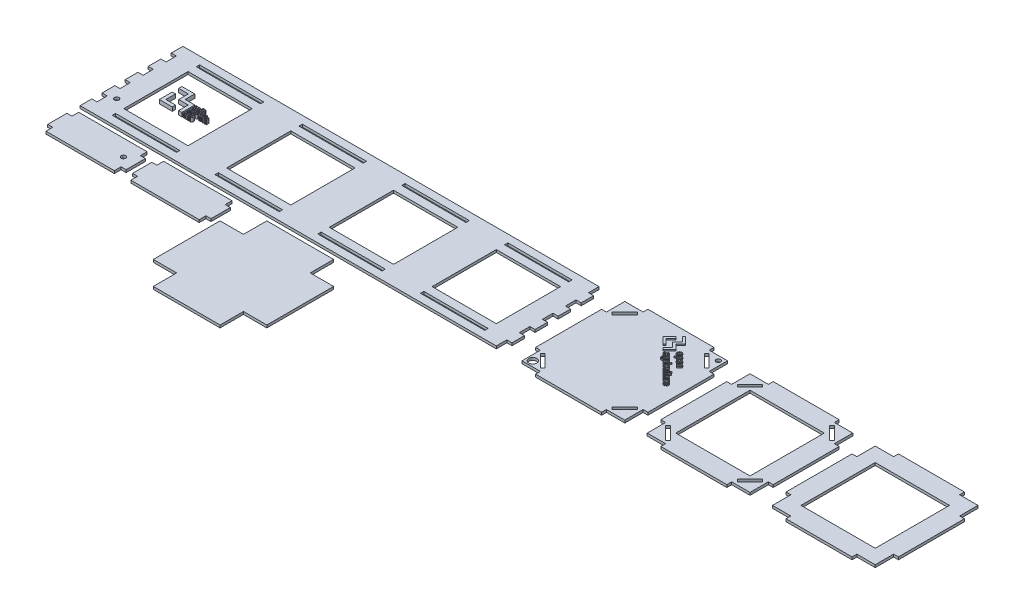
from build123d import *

# Parameters (mm, degrees)
BOSS_EXTRUDE1_DEPTH    = 2.54
SKETCH5_R              = 2.2225
SKETCH5_W              = 63.5
SKETCH5_H              = 3.302
SKETCH5_H_2            = 63.5
CUT_EXTRUDE2_DEPTH     = 265.025638907
BOSS_EXTRUDE2_DEPTH    = 2.54
SKETCH6_W              = 73.406
SKETCH6_H              = 73.406
BOSS_EXTRUDE2_2_DEPTH  = 2.54
BOSS_EXTRUDE2_3_DEPTH  = 2.54
BOSS_EXTRUDE3_DEPTH    = 2.54
BOSS_EXTRUDE3_2_DEPTH  = 2.54
CUT_EXTRUDE3_DEPTH     = 540.302793411
BOSS_EXTRUDE5_DEPTH    = 2.54
SKETCH14_R             = 2.2225
CUT_EXTRUDE4_DEPTH     = 559.151812216
BOSS_EXTRUDE7_DEPTH    = 3.81
BOSS_EXTRUDE7_2_DEPTH  = 3.81
BOSS_EXTRUDE7_3_DEPTH  = 3.81
BOSS_EXTRUDE7_4_DEPTH  = 3.81
BOSS_EXTRUDE7_5_DEPTH  = 3.81
SKETCH13_W             = 0.889033391
SKETCH13_H             = 0.770495605
BOSS_EXTRUDE7_6_DEPTH  = 3.81
SKETCH13_H_2           = 3.378326885
BOSS_EXTRUDE7_7_DEPTH  = 3.81
BOSS_EXTRUDE7_8_DEPTH  = 3.81
BOSS_EXTRUDE7_9_DEPTH  = 3.81
BOSS_EXTRUDE7_10_DEPTH = 3.81
BOSS_EXTRUDE7_11_DEPTH = 3.81
SKETCH13_H_3           = 0.770495606
BOSS_EXTRUDE7_12_DEPTH = 3.81
SKETCH13_H_4           = 3.378326886
BOSS_EXTRUDE7_13_DEPTH = 3.81
BOSS_EXTRUDE7_14_DEPTH = 3.81
SKETCH13_H_5           = 4.622973632
BOSS_EXTRUDE7_15_DEPTH = 3.81
BOSS_EXTRUDE7_16_DEPTH = 3.81
BOSS_EXTRUDE7_17_DEPTH = 3.81
BOSS_EXTRUDE7_18_DEPTH = 3.81
BOSS_EXTRUDE7_19_DEPTH = 3.81
BOSS_EXTRUDE7_20_DEPTH = 3.81
BOSS_EXTRUDE7_21_DEPTH = 3.81
BOSS_EXTRUDE7_22_DEPTH = 3.81
BOSS_EXTRUDE7_23_DEPTH = 3.81
BOSS_EXTRUDE7_24_DEPTH = 3.81
BOSS_EXTRUDE7_25_DEPTH = 3.81
BOSS_EXTRUDE7_26_DEPTH = 3.81
BOSS_EXTRUDE7_27_DEPTH = 3.81
BOSS_EXTRUDE7_28_DEPTH = 3.81
BOSS_EXTRUDE7_29_DEPTH = 3.81
BOSS_EXTRUDE7_30_DEPTH = 3.81
BOSS_EXTRUDE7_31_DEPTH = 3.81
BOSS_EXTRUDE7_32_DEPTH = 3.81
BOSS_EXTRUDE7_33_DEPTH = 3.81
SKETCH15_R             = 3.95
SKETCH15_R_2           = 2.2225
CUT_EXTRUDE5_DEPTH     = 559.151812217


with BuildPart() as part:
    # Sketch1 → Boss-Extrude1 (new body)
    with BuildSketch(Plane(origin=(0, 0, 0), x_dir=(1, 0, 0), z_dir=(0, 1, 0))):
        Polygon((50.8, 50.8), (152.4, 50.8), (152.4, 40.3352), (157.48, 40.3352), (157.48, 28.0162), (152.4, 28.0162), (152.4, 17.5514), (157.48, 17.5514), (157.48, 5.2324), (152.4, 5.2324), (152.4, -5.2324), (157.48, -5.2324), (157.48, -17.5514), (152.4, -17.5514), (152.4, -28.0162), (157.48, -28.0162), (157.48, -40.3352), (152.4, -40.3352), (152.4, -50.8), (50.8, -50.8), (-50.8, -50.8), (-152.4, -50.8), (-254, -50.8), (-259.08, -50.8), (-259.08, -39.2557), (-254, -39.2557), (-254, -29.0957), (-259.08, -29.0957), (-259.08, -16.4719), (-254, -16.4719), (-254, -6.3119), (-259.08, -6.3119), (-259.08, 6.3119), (-254, 6.3119), (-254, 16.4719), (-259.08, 16.4719), (-259.08, 29.0957), (-254, 29.0957), (-254, 39.2557), (-259.08, 39.2557), (-259.08, 50.8), (-254, 50.8), (-152.4, 50.8), (-50.8, 50.8), align=None)
    extrude(amount=BOSS_EXTRUDE1_DEPTH)

    # Sketch5 → Cut-Extrude2 (cut, through all)
    with BuildSketch(Plane(origin=(0, 2.54, 0), x_dir=(1, 0, 0), z_dir=(0, 1, 0))):
        with Locations((-246.95, -26.75)):
            Circle(SKETCH5_R)
        with Locations((-203.2, -41.529)):
            Rectangle(SKETCH5_W, SKETCH5_H)
        with Locations((-101.6, -41.529)):
            Rectangle(SKETCH5_W, SKETCH5_H)
        with Locations((0, -41.529)):
            Rectangle(SKETCH5_W, SKETCH5_H)
        with Locations((101.6, -41.529)):
            Rectangle(SKETCH5_W, SKETCH5_H)
        with Locations((101.6, 41.529)):
            Rectangle(SKETCH5_W, SKETCH5_H)
        with Locations((0, 41.529)):
            Rectangle(SKETCH5_W, SKETCH5_H)
        with Locations((-101.6, 41.529)):
            Rectangle(SKETCH5_W, SKETCH5_H)
        with Locations((-203.2, 41.529)):
            Rectangle(SKETCH5_W, SKETCH5_H)
        with Locations((-203.2, 0)):
            Rectangle(SKETCH5_W, SKETCH5_H_2)
        with Locations((-101.6, 0)):
            Rectangle(SKETCH5_W, SKETCH5_H_2)
        Rectangle(SKETCH5_W, SKETCH5_H_2)
        with Locations((101.6, 0)):
            Rectangle(SKETCH5_W, SKETCH5_H_2)
    extrude(amount=-CUT_EXTRUDE2_DEPTH, mode=Mode.SUBTRACT)


with BuildPart() as body_2:
    # Sketch6 → Boss-Extrude2 (new body)
    with BuildSketch(Plane(origin=(0, 0, 0), x_dir=(1, 0, 0), z_dir=(0, 1, 0))):
        Polygon((177.8, 32.639), (177.8, 50.8), (195.961, 50.8), (195.961, 55.5625), (261.239, 55.5625), (261.239, 50.8), (279.4, 50.8), (279.4, 32.639), (284.1625, 32.639), (284.1625, -32.639), (279.4, -32.639), (279.4, -50.8), (261.239, -50.8), (261.239, -55.5625), (195.961, -55.5625), (195.961, -50.8), (177.8, -50.8), (177.8, -32.639), (173.0375, -32.639), (173.0375, 32.639), align=None)
    extrude(amount=BOSS_EXTRUDE2_DEPTH)


with BuildPart() as body_3:
    # Sketch6 → Boss-Extrude2 2 (new body)
    with BuildSketch(Plane(origin=(0, 0, 0), x_dir=(1, 0, 0), z_dir=(0, 1, 0))):
        Polygon((296.8625, 32.639), (296.8625, -32.639), (301.625, -32.639), (301.625, -50.8), (319.786, -50.8), (319.786, -55.5625), (385.064, -55.5625), (385.064, -50.8), (403.225, -50.8), (403.225, -32.639), (407.9875, -32.639), (407.9875, 32.639), (403.225, 32.639), (403.225, 50.8), (385.064, 50.8), (385.064, 55.5625), (319.786, 55.5625), (319.786, 50.8), (301.625, 50.8), (301.625, 32.639), align=None)
        with Locations((352.425, 0)):
            Rectangle(SKETCH6_W, SKETCH6_H, mode=Mode.SUBTRACT)
    extrude(amount=BOSS_EXTRUDE2_2_DEPTH)


with BuildPart() as body_4:
    # Sketch6 → Boss-Extrude2 3 (new body)
    with BuildSketch(Plane(origin=(0, 0, 0), x_dir=(1, 0, 0), z_dir=(0, 1, 0))):
        Polygon((420.6875, 32.639), (420.6875, -32.639), (425.45, -32.639), (425.45, -50.8), (443.611, -50.8), (443.611, -55.5625), (508.889, -55.5625), (508.889, -50.8), (527.05, -50.8), (527.05, -32.639), (531.8125, -32.639), (531.8125, 32.639), (527.05, 32.639), (527.05, 50.8), (508.889, 50.8), (508.889, 55.5625), (443.611, 55.5625), (443.611, 50.8), (425.45, 50.8), (425.45, 32.639), align=None)
        with Locations((476.25, 0)):
            Rectangle(SKETCH6_W, SKETCH6_H, mode=Mode.SUBTRACT)
    extrude(amount=BOSS_EXTRUDE2_3_DEPTH)


with BuildPart() as body_5:
    # Sketch7 → Boss-Extrude3 (new body)
    with BuildSketch(Plane(origin=(0, 0, 0), x_dir=(1, 0, 0), z_dir=(0, 1, 0))):
        Polygon((-254.08, -57.15), (-186.516, -57.15), (-186.516, -63.8175), (-181.516, -63.8175), (-181.516, -82.8675), (-186.516, -82.8675), (-186.516, -89.535), (-254.08, -89.535), (-254.08, -82.8675), (-259.08, -82.8675), (-259.08, -63.8175), (-254.08, -63.8175), align=None)
    extrude(amount=BOSS_EXTRUDE3_DEPTH)

    # Sketch14 → Cut-Extrude4 (cut, through all)
    with BuildSketch(Plane(origin=(0, 2.54, 0), x_dir=(1, 0, 0), z_dir=(0, 1, 0))):
        with Locations((-193.7385, -73.3425)):
            Circle(SKETCH14_R)
    extrude(amount=-CUT_EXTRUDE4_DEPTH, mode=Mode.SUBTRACT)


with BuildPart() as body_6:
    # Sketch7 → Boss-Extrude3 2 (new body)
    with BuildSketch(Plane(origin=(0, 0, 0), x_dir=(1, 0, 0), z_dir=(0, 1, 0))):
        Polygon((-170.166, -57.15), (-102.602, -57.15), (-102.602, -63.8175), (-97.602, -63.8175), (-97.602, -82.8675), (-102.602, -82.8675), (-102.602, -89.535), (-170.166, -89.535), (-170.166, -82.8675), (-175.166, -82.8675), (-175.166, -63.8175), (-170.166, -63.8175), align=None)
    extrude(amount=BOSS_EXTRUDE3_2_DEPTH)


with BuildPart() as cut_extrude3_tool:
    # Sketch8 → Cut-Extrude3 (new, through all)
    with BuildSketch(Plane(origin=(0, 2.54, 0), x_dir=(1, 0, 0), z_dir=(0, 1, 0))):
        Polygon((180.594320715, -35.433320715), (193.166679285, -48.005679285), (195.501545876, -45.670812693), (182.929187307, -33.098454124), align=None)
        Polygon((195.501545876, 45.670812693), (182.929187307, 33.098454124), (180.594320715, 35.433320715), (193.166679285, 48.005679285), align=None)
        Polygon((274.270812693, 33.098454124), (261.698454124, 45.670812693), (264.033320715, 48.005679285), (276.605679285, 35.433320715), align=None)
        Polygon((261.698454124, -45.670812693), (274.270812693, -33.098454124), (276.605679285, -35.433320715), (264.033320715, -48.005679285), align=None)
        Polygon((304.419320715, -35.433320715), (306.754187307, -33.098454124), (319.326545876, -45.670812693), (316.991679285, -48.005679285), align=None)
        Polygon((306.754187307, 33.098454124), (304.419320715, 35.433320715), (316.991679285, 48.005679285), (319.326545876, 45.670812693), align=None)
        Polygon((385.523454124, 45.670812693), (387.858320715, 48.005679285), (400.430679285, 35.433320715), (398.095812693, 33.098454124), align=None)
        Polygon((398.095812693, -33.098454124), (400.430679285, -35.433320715), (387.858320715, -48.005679285), (385.523454124, -45.670812693), align=None)
    extrude(amount=-CUT_EXTRUDE3_DEPTH)


with BuildPart() as body_2_1:
    add(body_2.part)

    # Cut-Extrude3: cut by cut_extrude3_tool
    add(cut_extrude3_tool.part, mode=Mode.SUBTRACT)

    # Sketch15 → Cut-Extrude5 (cut, through all)
    with BuildSketch(Plane(origin=(0, 2.54, 0), x_dir=(1, 0, 0), z_dir=(0, 1, 0))):
        with Locations((183.119233747, -45.480766253)):
            Circle(SKETCH15_R)
        with Locations((274.85975, 46.25975)):
            Circle(SKETCH15_R_2)
    extrude(amount=-CUT_EXTRUDE5_DEPTH, mode=Mode.SUBTRACT)


with BuildPart() as body_3_1:
    add(body_3.part)

    # Cut-Extrude3: cut by cut_extrude3_tool
    add(cut_extrude3_tool.part, mode=Mode.SUBTRACT)


with BuildPart() as body_7:
    # Sketch11 → Boss-Extrude5 (new body)
    with BuildSketch(Plane(origin=(0, 0, 0), x_dir=(1, 0, 0), z_dir=(0, 1, 0))):
        Polygon((-68.138, -80.264), (-91.252, -80.264), (-91.252, -146.304), (-68.138, -146.304), (-68.138, -169.418), (-2.098, -169.418), (-2.098, -146.304), (21.016, -146.304), (21.016, -80.264), (-2.098, -80.264), (-2.098, -57.15), (-68.138, -57.15), align=None)
    extrude(amount=BOSS_EXTRUDE5_DEPTH)


with BuildPart() as body_8:
    # Sketch13 → Boss-Extrude7 (new body)
    with BuildSketch(Plane(origin=(0, 0, 0), x_dir=(1, 0, 0), z_dir=(0, 1, 0))):
        Polygon((-223.944332906, 14.661616119), (-211.179668955, 14.661616119), (-211.179668955, 5.178647687), (-201.719332906, 5.178647687), (-201.719332906, -7.608648647), (-204.910498894, -7.608648647), (-204.910498894, 1.942216934), (-214.34820256, 1.942216934), (-214.34820256, 11.470450131), (-223.944332906, 11.470450131), align=None)
    extrude(amount=BOSS_EXTRUDE7_DEPTH)


with BuildPart() as body_9:
    # Sketch13 → Boss-Extrude7 2 (new body)
    with BuildSketch(Plane(origin=(0, 0, 0), x_dir=(1, 0, 0), z_dir=(0, 1, 0))):
        Polygon((239.1402311, 49.535325027), (245.587359985, 43.088196142), (240.797737639, 38.298573796), (245.575928905, 33.52038253), (239.117368941, 27.061822565), (237.505586719, 28.673604787), (242.329502304, 33.497520371), (237.562742117, 38.264280558), (242.375226622, 43.076765062), (237.528448878, 47.923542806), align=None)
    extrude(amount=BOSS_EXTRUDE7_2_DEPTH)


with BuildPart() as body_10:
    # Sketch13 → Boss-Extrude7 3 (new body)
    with BuildSketch(Plane(origin=(0, 0, 0), x_dir=(1, 0, 0), z_dir=(0, 1, 0))):
        Polygon((234.350608754, 44.745702682), (235.973822055, 43.122489381), (231.138475391, 38.287142717), (235.962390975, 33.463227132), (234.339177675, 31.840013831), (227.892048789, 38.287142717), align=None)
    extrude(amount=BOSS_EXTRUDE7_3_DEPTH)


with BuildPart() as body_11:
    # Sketch13 → Boss-Extrude7 4 (new body)
    with BuildSketch(Plane(origin=(0, 0, 0), x_dir=(1, 0, 0), z_dir=(0, 1, 0))):
        Polygon((-223.944332906, 5.178647687), (-220.730534535, 5.178647687), (-220.730534535, -4.394850276), (-211.179668955, -4.394850276), (-211.179668955, -7.608648647), (-223.944332906, -7.608648647), align=None)
    extrude(amount=BOSS_EXTRUDE7_4_DEPTH)


with BuildPart() as body_12:
    # Sketch13 → Boss-Extrude7 5 (new body)
    with BuildSketch(Plane(origin=(0, 0, 0), x_dir=(1, 0, 0), z_dir=(0, 1, 0))):
        with BuildLine():
            Line((-200.498406195, 5.320543819), (-199.609372804, 5.320543819))
            Line((-199.609372804, 5.320543819), (-199.609372804, 4.867692436))
            add(Edge.make_bspline(
                [(-199.609372804, 4.867692436), (-199.574407073, 4.908620525), (-199.506204678, 4.988452795), (-199.392068255, 5.092180744), (-199.274064444, 5.181346788), (-199.150703442, 5.253783352), (-199.02211621, 5.310452487), (-198.888276949, 5.349922399), (-198.749361443, 5.374969606), (-198.655002556, 5.37818777), (-198.607358086, 5.379812712)],
                knots=[0, 0, 0, 0, 1.107989097, 2.161187726, 3.169782568, 4.150299753, 5.101422349, 6.057126037, 7.018988, 8, 8, 8, 8], degree=3))
            add(Edge.make_bspline(
                [(-198.607358086, 5.379812712), (-198.557586002, 5.378083953), (-198.460571565, 5.374714301), (-198.319767091, 5.352271201), (-198.189969241, 5.310630654), (-198.069977842, 5.255025166), (-197.960190972, 5.182910554), (-197.86133589, 5.093686138), (-197.77242436, 4.988334941), (-197.72377622, 4.908535467), (-197.69887709, 4.867692436)],
                knots=[0, 0, 0, 0, 1.087442074, 2.119613481, 3.102840357, 4.056171906, 5.000733146, 5.960649063, 6.95621775, 8, 8, 8, 8], degree=3))
            add(Edge.make_bspline(
                [(-197.69887709, 4.867692436), (-197.66232208, 4.908609573), (-197.590777141, 4.988692006), (-197.472693825, 5.0926344), (-197.351753437, 5.182503827), (-197.22508518, 5.253770075), (-197.094071492, 5.310003707), (-196.959164228, 5.351203441), (-196.818994252, 5.374673624), (-196.724420517, 5.378084177), (-196.676488691, 5.379812712)],
                knots=[0, 0, 0, 0, 1.113435884, 2.179200698, 3.188655475, 4.168472025, 5.123401892, 6.079401341, 7.026602871, 8, 8, 8, 8], degree=3))
            add(Edge.make_bspline(
                [(-196.676488691, 5.379812712), (-196.617405007, 5.378223851), (-196.502810995, 5.375142222), (-196.338364703, 5.346106293), (-196.187777919, 5.298704524), (-196.051748987, 5.23298845), (-195.930188311, 5.148836315), (-195.8259947, 5.045679711), (-195.736597905, 4.925411933), (-195.693069941, 4.834583263), (-195.670769667, 4.788049861)],
                knots=[0, 0, 0, 0, 1.140878793, 2.212757745, 3.214472279, 4.182883268, 5.121137096, 6.057549851, 7.004842706, 8, 8, 8, 8], degree=3))
            add(Edge.make_bspline(
                [(-195.670769667, 4.788049861), (-195.66336462, 4.768705786), (-195.647815203, 4.728086318), (-195.629535813, 4.661420795), (-195.614174761, 4.586832272), (-195.601149048, 4.503700528), (-195.591365756, 4.412521487), (-195.583626879, 4.312784047), (-195.580621321, 4.204947093), (-195.579610237, 4.130226967), (-195.579088099, 4.091640372)],
                knots=[0, 0, 0, 0, 0.70348757, 1.477211565, 2.345356006, 3.290383569, 4.335215205, 5.460703428, 6.68866909, 8, 8, 8, 8], degree=3))
            Line((-195.579088099, 4.091640372), (-195.579088099, 1.942216934))
            Line((-195.579088099, 1.942216934), (-196.46812149, 1.942216934))
            Line((-196.46812149, 1.942216934), (-196.46812149, 3.883273171))
            add(Edge.make_bspline(
                [(-196.46812149, 3.883273171), (-196.468639436, 3.923403333), (-196.469631714, 4.000284427), (-196.472609626, 4.109973335), (-196.480181651, 4.208503671), (-196.490082782, 4.295665819), (-196.502715905, 4.371828204), (-196.518323279, 4.436834232), (-196.535863627, 4.491378021), (-196.552305401, 4.522132594), (-196.559803058, 4.536157067)],
                knots=[0, 0, 0, 0, 1.448583407, 2.775186282, 3.959557885, 5.014017743, 5.940851432, 6.743435621, 7.42699079, 8, 8, 8, 8], degree=3))
            add(Edge.make_bspline(
                [(-196.559803058, 4.536157067), (-196.570161354, 4.551630822), (-196.590496707, 4.582008817), (-196.628111569, 4.620899722), (-196.669459736, 4.654027357), (-196.71515556, 4.680709904), (-196.764429966, 4.702440095), (-196.818140431, 4.716945254), (-196.875856757, 4.726678104), (-196.915990272, 4.727454132), (-196.936716173, 4.727854892)],
                knots=[0, 0, 0, 0, 1.007330723, 1.977586358, 2.91811154, 3.870610884, 4.837109745, 5.827490497, 6.87806446, 8, 8, 8, 8], degree=3))
            add(Edge.make_bspline(
                [(-196.936716173, 4.727854892), (-196.967397109, 4.72636791), (-197.028571805, 4.723403017), (-197.118730631, 4.701241979), (-197.205828261, 4.664548622), (-197.288467574, 4.613636415), (-197.365511886, 4.550293248), (-197.429498008, 4.470416455), (-197.484075631, 4.378844842), (-197.518120283, 4.29161005), (-197.539928546, 4.213422287), (-197.554401707, 4.145654417), (-197.567804026, 4.070081078), (-197.57599382, 3.985811291), (-197.584965097, 3.894216174), (-197.589935152, 3.794100174), (-197.594030483, 3.686361977), (-197.594162354, 3.611629001), (-197.594230451, 3.57303756)],
                knots=[0, 0, 0, 0, 0.980756864, 1.955530408, 2.951333081, 3.992841588, 5.051067304, 6.124479263, 7.24895299, 8.449987866, 9.106471564, 9.844417254, 10.665838362, 11.560007627, 12.551443477, 13.609669193, 14.765654547, 16, 16, 16, 16], degree=3))
            Line((-197.594230451, 3.57303756), (-197.594230451, 1.942216934))
            Line((-197.594230451, 1.942216934), (-198.483263842, 1.942216934))
            Line((-198.483263842, 1.942216934), (-198.483263842, 3.803630596))
            add(Edge.make_bspline(
                [(-198.483263842, 3.803630596), (-198.48351369, 3.843143723), (-198.483989988, 3.918469852), (-198.485584621, 4.025914874), (-198.489071858, 4.122270538), (-198.494875763, 4.20745063), (-198.500828244, 4.281967546), (-198.509245512, 4.34524419), (-198.517905972, 4.398014729), (-198.532564355, 4.452189067), (-198.553941277, 4.509480249), (-198.587685837, 4.568109158), (-198.62675081, 4.618706073), (-198.674008757, 4.659295679), (-198.729179192, 4.690256931), (-198.792342115, 4.712717878), (-198.864318465, 4.725232436), (-198.915076054, 4.726953238), (-198.941671684, 4.727854892)],
                knots=[0, 0, 0, 0, 1.59971622, 3.049630259, 4.350321007, 5.502524502, 6.50613666, 7.375761863, 8.086687183, 8.668722719, 9.645840515, 10.55265597, 11.397779758, 12.221945254, 13.055906891, 13.945332132, 14.923408514, 16, 16, 16, 16], degree=3))
            add(Edge.make_bspline(
                [(-198.941671684, 4.727854892), (-198.97480167, 4.726330443), (-199.039848082, 4.723337387), (-199.135051627, 4.702591511), (-199.224621766, 4.666931011), (-199.308128271, 4.617742253), (-199.383962562, 4.555623367), (-199.44821618, 4.479358239), (-199.501552657, 4.391355426), (-199.535254295, 4.3079778), (-199.55711981, 4.232997333), (-199.57048404, 4.166928812), (-199.582504803, 4.092479146), (-199.592718277, 4.009404844), (-199.599740234, 3.917303917), (-199.605174411, 3.816645052), (-199.609152017, 3.707349702), (-199.609297441, 3.631692913), (-199.609372804, 3.592485166)],
                knots=[0, 0, 0, 0, 1.061105177, 2.08334182, 3.104381884, 4.137278018, 5.176827868, 6.229094397, 7.316239487, 8.460364206, 9.09881589, 9.816452537, 10.617971519, 11.514628853, 12.496857794, 13.576419947, 14.74402393, 16, 16, 16, 16], degree=3))
            Line((-199.609372804, 3.592485166), (-199.609372804, 1.942216934))
            Line((-199.609372804, 1.942216934), (-200.498406195, 1.942216934))
            Line((-200.498406195, 1.942216934), (-200.498406195, 5.320543819))
        make_face()
    extrude(amount=BOSS_EXTRUDE7_5_DEPTH)


with BuildPart() as body_13:
    # Sketch13 → Boss-Extrude7 6 (new body)
    with BuildSketch(Plane(origin=(0, 0, 0), x_dir=(1, 0, 0), z_dir=(0, 1, 0))):
        with Locations((-194.245538013, 6.179942763)):
            Rectangle(SKETCH13_W, SKETCH13_H)
    extrude(amount=BOSS_EXTRUDE7_6_DEPTH)


with BuildPart() as body_14:
    # Sketch13 → Boss-Extrude7 7 (new body)
    with BuildSketch(Plane(origin=(0, 0, 0), x_dir=(1, 0, 0), z_dir=(0, 1, 0))):
        with Locations((-194.245538013, 3.631380377)):
            Rectangle(SKETCH13_W, SKETCH13_H_2)
    extrude(amount=BOSS_EXTRUDE7_7_DEPTH)


with BuildPart() as body_15:
    # Sketch13 → Boss-Extrude7 8 (new body)
    with BuildSketch(Plane(origin=(0, 0, 0), x_dir=(1, 0, 0), z_dir=(0, 1, 0))):
        with BuildLine():
            Line((-191.311727822, 5.320543819), (-191.311727822, 4.668585999))
            Line((-191.311727822, 4.668585999), (-191.963685642, 4.668585999))
            Line((-191.963685642, 4.668585999), (-191.963685642, 3.216498127))
            add(Edge.make_bspline(
                [(-191.963685642, 3.216498127), (-191.963753292, 3.181615844), (-191.963880813, 3.11586274), (-191.9630419, 3.022938717), (-191.961070167, 2.941447566), (-191.959022693, 2.871385342), (-191.95799284, 2.812657473), (-191.95399024, 2.765751528), (-191.95035415, 2.730259295), (-191.944711139, 2.686548863), (-191.918791149, 2.633669834), (-191.875742138, 2.587453943), (-191.831489415, 2.560626694), (-191.793925098, 2.545827568), (-191.753022768, 2.536166425), (-191.724504828, 2.535332001), (-191.709940695, 2.534905861)],
                knots=[0, 0, 0, 0, 1.772607892, 3.341365874, 4.72216035, 5.914769548, 6.903535532, 7.706019004, 8.305410619, 8.718065781, 9.939723765, 11.215765275, 11.877591902, 12.553399735, 13.261220211, 14, 14, 14, 14], degree=3))
            add(Edge.make_bspline(
                [(-191.709940695, 2.534905861), (-191.686113438, 2.536253448), (-191.633422795, 2.539233448), (-191.547932929, 2.556354653), (-191.448850059, 2.583602378), (-191.378899936, 2.60735722), (-191.341362269, 2.620104894)],
                knots=[0, 0, 0, 0, 0.753421026, 1.666085143, 2.747540144, 4, 4, 4, 4], degree=3))
            Line((-191.341362269, 2.620104894), (-191.252458929, 2.00055975))
            add(Edge.make_bspline(
                [(-191.252458929, 2.00055975), (-191.306446419, 1.982038649), (-191.416271475, 1.944361756), (-191.591204392, 1.910083833), (-191.775673394, 1.886801534), (-191.902484758, 1.884252632), (-191.967389948, 1.882948041)],
                knots=[0, 0, 0, 0, 0.939547081, 1.911291127, 2.930947196, 4, 4, 4, 4], degree=3))
            add(Edge.make_bspline(
                [(-191.967389948, 1.882948041), (-192.007252174, 1.884132492), (-192.085095323, 1.886445495), (-192.199083239, 1.901106307), (-192.306747118, 1.927101381), (-192.407313254, 1.962930277), (-192.498134389, 2.006958473), (-192.578124948, 2.056379074), (-192.643739902, 2.113874414), (-192.69854891, 2.177334154), (-192.741779743, 2.251019069), (-192.77610046, 2.33486894), (-192.805596196, 2.429253061), (-192.817679301, 2.496756739), (-192.824010663, 2.532127632)],
                knots=[0, 0, 0, 0, 1.203015215, 2.349253984, 3.460901624, 4.539344044, 5.564274864, 6.502382232, 7.367332183, 8.186789841, 9.022345106, 9.932420497, 10.916620053, 12, 12, 12, 12], degree=3))
            add(Edge.make_bspline(
                [(-192.824010663, 2.532127632), (-192.82623066, 2.54693585), (-192.831169779, 2.579881644), (-192.837871101, 2.634471823), (-192.842006083, 2.699403351), (-192.845394555, 2.774443762), (-192.849741111, 2.859608919), (-192.850660087, 2.954732256), (-192.853319819, 3.059979327), (-192.852925905, 3.133457729), (-192.852719033, 3.172046458)],
                knots=[0, 0, 0, 0, 0.560521704, 1.24706641, 2.057998689, 2.995119087, 4.059211621, 5.249632546, 6.555586685, 8, 8, 8, 8], degree=3))
            Line((-192.852719033, 3.172046458), (-192.852719033, 4.668585999))
            Line((-192.852719033, 4.668585999), (-193.267601282, 4.668585999))
            Line((-193.267601282, 4.668585999), (-193.267601282, 5.320543819))
            Line((-193.267601282, 5.320543819), (-192.852719033, 5.320543819))
            Line((-192.852719033, 5.320543819), (-192.852719033, 5.972501639))
            Line((-192.852719033, 5.972501639), (-191.963685642, 6.505921674))
            Line((-191.963685642, 6.505921674), (-191.963685642, 5.320543819))
            Line((-191.963685642, 5.320543819), (-191.311727822, 5.320543819))
        make_face()
    extrude(amount=BOSS_EXTRUDE7_8_DEPTH)


with BuildPart() as body_16:
    # Sketch13 → Boss-Extrude7 9 (new body)
    with BuildSketch(Plane(origin=(0, 0, 0), x_dir=(1, 0, 0), z_dir=(0, 1, 0))):
        with BuildLine():
            Line((-200.498406195, 1.022647972), (-199.609372804, 1.022647972))
            Line((-199.609372804, 1.022647972), (-199.609372804, 0.569796588))
            add(Edge.make_bspline(
                [(-199.609372804, 0.569796588), (-199.574407073, 0.610724678), (-199.506204678, 0.690556948), (-199.392068255, 0.794284897), (-199.274064444, 0.883450941), (-199.150703442, 0.955887505), (-199.02211621, 1.01255664), (-198.888276949, 1.052026552), (-198.749361443, 1.077073758), (-198.655002556, 1.080291922), (-198.607358086, 1.081916864)],
                knots=[0, 0, 0, 0, 1.107989097, 2.161187726, 3.169782568, 4.150299753, 5.101422349, 6.057126037, 7.018988, 8, 8, 8, 8], degree=3))
            add(Edge.make_bspline(
                [(-198.607358086, 1.081916864), (-198.557586002, 1.080188105), (-198.460571565, 1.076818453), (-198.319767091, 1.054375354), (-198.189969241, 1.012734806), (-198.069977842, 0.957129319), (-197.960190972, 0.885014706), (-197.86133589, 0.79579029), (-197.77242436, 0.690439094), (-197.72377622, 0.61063962), (-197.69887709, 0.569796588)],
                knots=[0, 0, 0, 0, 1.087442074, 2.119613481, 3.102840357, 4.056171906, 5.000733146, 5.960649063, 6.95621775, 8, 8, 8, 8], degree=3))
            add(Edge.make_bspline(
                [(-197.69887709, 0.569796588), (-197.66232208, 0.610713725), (-197.590777141, 0.690796158), (-197.472693825, 0.794738552), (-197.351753437, 0.88460798), (-197.22508518, 0.955874228), (-197.094071492, 1.012107859), (-196.959164228, 1.053307593), (-196.818994252, 1.076777776), (-196.724420517, 1.080188329), (-196.676488691, 1.081916864)],
                knots=[0, 0, 0, 0, 1.113435884, 2.179200698, 3.188655475, 4.168472025, 5.123401892, 6.079401341, 7.026602871, 8, 8, 8, 8], degree=3))
            add(Edge.make_bspline(
                [(-196.676488691, 1.081916864), (-196.617405007, 1.080328003), (-196.502810995, 1.077246374), (-196.338364703, 1.048210445), (-196.187777919, 1.000808677), (-196.051748987, 0.935092602), (-195.930188311, 0.850940467), (-195.8259947, 0.747783863), (-195.736597905, 0.627516085), (-195.693069941, 0.536687415), (-195.670769667, 0.490154014)],
                knots=[0, 0, 0, 0, 1.140878793, 2.212757745, 3.214472279, 4.182883268, 5.121137096, 6.057549851, 7.004842706, 8, 8, 8, 8], degree=3))
            add(Edge.make_bspline(
                [(-195.670769667, 0.490154014), (-195.66336462, 0.470809939), (-195.647815203, 0.43019047), (-195.629535813, 0.363524948), (-195.614174761, 0.288936425), (-195.601149048, 0.20580468), (-195.591365756, 0.11462564), (-195.583626879, 0.014888199), (-195.580621321, -0.092948755), (-195.579610237, -0.16766888), (-195.579088099, -0.206255476)],
                knots=[0, 0, 0, 0, 0.70348757, 1.477211565, 2.345356006, 3.290383569, 4.335215205, 5.460703428, 6.68866909, 8, 8, 8, 8], degree=3))
            Line((-195.579088099, -0.206255476), (-195.579088099, -2.355678914))
            Line((-195.579088099, -2.355678914), (-196.46812149, -2.355678914))
            Line((-196.46812149, -2.355678914), (-196.46812149, -0.414622677))
            add(Edge.make_bspline(
                [(-196.46812149, -0.414622677), (-196.468639436, -0.374492514), (-196.469631714, -0.29761142), (-196.472609626, -0.187922512), (-196.480181651, -0.089392176), (-196.490082782, -0.002230029), (-196.502715905, 0.073932356), (-196.518323279, 0.138938385), (-196.535863627, 0.193482174), (-196.552305401, 0.224236746), (-196.559803058, 0.238261219)],
                knots=[0, 0, 0, 0, 1.448583407, 2.775186282, 3.959557885, 5.014017743, 5.940851432, 6.743435621, 7.42699079, 8, 8, 8, 8], degree=3))
            add(Edge.make_bspline(
                [(-196.559803058, 0.238261219), (-196.570161354, 0.253734975), (-196.590496707, 0.28411297), (-196.628111569, 0.323003875), (-196.669459736, 0.35613151), (-196.71515556, 0.382814057), (-196.764429966, 0.404544248), (-196.818140431, 0.419049406), (-196.875856757, 0.428782256), (-196.915990272, 0.429558285), (-196.936716173, 0.429959044)],
                knots=[0, 0, 0, 0, 1.007330723, 1.977586358, 2.91811154, 3.870610884, 4.837109745, 5.827490497, 6.87806446, 8, 8, 8, 8], degree=3))
            add(Edge.make_bspline(
                [(-196.936716173, 0.429959044), (-196.967397109, 0.428472062), (-197.028571805, 0.42550717), (-197.118730631, 0.403346132), (-197.205828261, 0.366652774), (-197.288467574, 0.315740567), (-197.365511886, 0.2523974), (-197.429498008, 0.172520608), (-197.484075631, 0.080948994), (-197.518120283, -0.006285797), (-197.539928546, -0.08447356), (-197.554401707, -0.15224143), (-197.567804026, -0.22781477), (-197.57599382, -0.312084557), (-197.584965097, -0.403679674), (-197.589935152, -0.503795673), (-197.594030483, -0.61153387), (-197.594162354, -0.686266847), (-197.594230451, -0.724858287)],
                knots=[0, 0, 0, 0, 0.980756864, 1.955530408, 2.951333081, 3.992841588, 5.051067304, 6.124479263, 7.24895299, 8.449987866, 9.106471564, 9.844417254, 10.665838362, 11.560007627, 12.551443477, 13.609669193, 14.765654547, 16, 16, 16, 16], degree=3))
            Line((-197.594230451, -0.724858287), (-197.594230451, -2.355678914))
            Line((-197.594230451, -2.355678914), (-198.483263842, -2.355678914))
            Line((-198.483263842, -2.355678914), (-198.483263842, -0.494265252))
            add(Edge.make_bspline(
                [(-198.483263842, -0.494265252), (-198.48351369, -0.454752124), (-198.483989988, -0.379425996), (-198.485584621, -0.271980973), (-198.489071858, -0.175625309), (-198.494875763, -0.090445218), (-198.500828244, -0.015928301), (-198.509245512, 0.047348343), (-198.517905972, 0.100118881), (-198.532564355, 0.15429322), (-198.553941277, 0.211584402), (-198.587685837, 0.270213311), (-198.62675081, 0.320810226), (-198.674008757, 0.361399831), (-198.729179192, 0.392361084), (-198.792342115, 0.41482203), (-198.864318465, 0.427336589), (-198.915076054, 0.42905739), (-198.941671684, 0.429959044)],
                knots=[0, 0, 0, 0, 1.59971622, 3.049630259, 4.350321007, 5.502524502, 6.50613666, 7.375761863, 8.086687183, 8.668722719, 9.645840515, 10.55265597, 11.397779758, 12.221945254, 13.055906891, 13.945332132, 14.923408514, 16, 16, 16, 16], degree=3))
            add(Edge.make_bspline(
                [(-198.941671684, 0.429959044), (-198.97480167, 0.428434596), (-199.039848082, 0.42544154), (-199.135051627, 0.404695663), (-199.224621766, 0.369035164), (-199.308128271, 0.319846406), (-199.383962562, 0.257727519), (-199.44821618, 0.181462391), (-199.501552657, 0.093459578), (-199.535254295, 0.010081953), (-199.55711981, -0.064898514), (-199.57048404, -0.130967035), (-199.582504803, -0.205416701), (-199.592718277, -0.288491004), (-199.599740234, -0.380591931), (-199.605174411, -0.481250795), (-199.609152017, -0.590546146), (-199.609297441, -0.666202934), (-199.609372804, -0.705410682)],
                knots=[0, 0, 0, 0, 1.061105177, 2.08334182, 3.104381884, 4.137278018, 5.176827868, 6.229094397, 7.316239487, 8.460364206, 9.09881589, 9.816452537, 10.617971519, 11.514628853, 12.496857794, 13.576419947, 14.74402393, 16, 16, 16, 16], degree=3))
            Line((-199.609372804, -0.705410682), (-199.609372804, -2.355678914))
            Line((-199.609372804, -2.355678914), (-200.498406195, -2.355678914))
            Line((-200.498406195, -2.355678914), (-200.498406195, 1.022647972))
        make_face()
    extrude(amount=BOSS_EXTRUDE7_9_DEPTH)


with BuildPart() as body_17:
    # Sketch13 → Boss-Extrude7 10 (new body)
    with BuildSketch(Plane(origin=(0, 0, 0), x_dir=(1, 0, 0), z_dir=(0, 1, 0))):
        with BuildLine():
            Line((-192.79345014, -1.288838845), (-191.904416749, -1.40737663))
            add(Edge.make_bspline(
                [(-191.904416749, -1.40737663), (-191.918958133, -1.4474322), (-191.947549593, -1.52618999), (-191.999786377, -1.638489112), (-192.058176819, -1.743299392), (-192.122440206, -1.841180829), (-192.192337376, -1.932261128), (-192.27017956, -2.014624348), (-192.35217465, -2.091336595), (-192.441752466, -2.158745081), (-192.53666851, -2.219367659), (-192.637399781, -2.272411773), (-192.744751846, -2.315611475), (-192.85709905, -2.351788304), (-192.974951349, -2.380664694), (-193.098789557, -2.400852129), (-193.228454791, -2.413117419), (-193.316964469, -2.414329989), (-193.36206108, -2.414947807)],
                knots=[0, 0, 0, 0, 1.071172907, 2.106154283, 3.1104349, 4.085737425, 5.048416355, 5.993087888, 6.932482331, 7.868664062, 8.80754521, 9.762367971, 10.726735429, 11.713584758, 12.728370439, 13.774815933, 14.866245336, 16, 16, 16, 16], degree=3))
            add(Edge.make_bspline(
                [(-193.36206108, -2.414947807), (-193.432532085, -2.413208451), (-193.569381415, -2.409830755), (-193.767370594, -2.382687476), (-193.951260447, -2.338494846), (-194.121405142, -2.276594463), (-194.277239152, -2.195396696), (-194.418997133, -2.096661985), (-194.546957091, -1.980175747), (-194.61867885, -1.889986737), (-194.654863803, -1.844484714)],
                knots=[0, 0, 0, 0, 1.150944905, 2.235047425, 3.25761485, 4.235688044, 5.185329112, 6.119879054, 7.051444229, 8, 8, 8, 8], degree=3))
            add(Edge.make_bspline(
                [(-194.654863803, -1.844484714), (-194.681568307, -1.805762768), (-194.735343383, -1.727788073), (-194.802187778, -1.601441644), (-194.859345325, -1.467970217), (-194.904880626, -1.326991476), (-194.942733079, -1.179041068), (-194.968200725, -1.023179069), (-194.9828795, -0.859732568), (-194.985210076, -0.748349108), (-194.986399171, -0.691519535)],
                knots=[0, 0, 0, 0, 0.92479112, 1.862259343, 2.806490716, 3.778329015, 4.774107667, 5.808532634, 6.881879269, 8, 8, 8, 8], degree=3))
            add(Edge.make_bspline(
                [(-194.986399171, -0.691519535), (-194.985421226, -0.624153212), (-194.983509447, -0.492459292), (-194.960875522, -0.301021445), (-194.928937758, -0.119991289), (-194.880230515, 0.048750467), (-194.819352977, 0.207128664), (-194.742949301, 0.353106638), (-194.654819778, 0.4893397), (-194.551776226, 0.611713459), (-194.438853084, 0.721746666), (-194.318681679, 0.818704383), (-194.190362396, 0.89968973), (-194.055806519, 0.96728384), (-193.912775139, 1.017879531), (-193.763058423, 1.055124602), (-193.606001758, 1.077806348), (-193.498886541, 1.080532321), (-193.444481884, 1.081916864)],
                knots=[0, 0, 0, 0, 1.222152375, 2.389176539, 3.494777592, 4.555389183, 5.572001132, 6.56945427, 7.540785438, 8.511469914, 9.46642023, 10.399267108, 11.30862844, 12.215760073, 13.126777173, 14.056336669, 15.012798191, 16, 16, 16, 16], degree=3))
            add(Edge.make_bspline(
                [(-193.444481884, 1.081916864), (-193.383592029, 1.080629478), (-193.264436966, 1.078110198), (-193.090709317, 1.054459436), (-192.926680524, 1.015990913), (-192.772886386, 0.960713853), (-192.628324033, 0.891399101), (-192.494068625, 0.805497461), (-192.370113271, 0.703793412), (-192.25676408, 0.586330318), (-192.15418113, 0.453880552), (-192.066867048, 0.303889262), (-191.993773095, 0.137906734), (-191.934514839, -0.044494958), (-191.890705903, -0.243697677), (-191.860730001, -0.459183015), (-191.843635236, -0.690931197), (-191.844633137, -0.850776767), (-191.845147857, -0.933225488)],
                knots=[0, 0, 0, 0, 0.994942504, 1.946998194, 2.860087576, 3.744358974, 4.613292, 5.475605888, 6.343365869, 7.228414471, 8.138836547, 9.075277299, 10.058013037, 11.098483422, 12.205225682, 13.387753975, 14.652597341, 16, 16, 16, 16], degree=3))
            Line((-191.845147857, -0.933225488), (-194.09736578, -0.933225488))
            add(Edge.make_bspline(
                [(-194.09736578, -0.933225488), (-194.095907772, -0.96504627), (-194.093068563, -1.027011538), (-194.082313885, -1.117588018), (-194.063695699, -1.202371788), (-194.039330523, -1.281877219), (-194.010357957, -1.356160103), (-193.973502559, -1.424507137), (-193.931040403, -1.487790248), (-193.881951474, -1.544977474), (-193.828203102, -1.595742916), (-193.771486466, -1.64035612), (-193.711888624, -1.679366826), (-193.647869823, -1.709036957), (-193.581558497, -1.734090036), (-193.511760912, -1.750148699), (-193.438944242, -1.760819647), (-193.389265906, -1.762256638), (-193.363913233, -1.762989987)],
                knots=[0, 0, 0, 0, 1.231756261, 2.398624542, 3.522625857, 4.583815436, 5.612473245, 6.600564899, 7.580690863, 8.554470542, 9.508734211, 10.435415665, 11.342824763, 12.255949018, 13.158633635, 14.07945191, 15.019874036, 16, 16, 16, 16], degree=3))
            add(Edge.make_bspline(
                [(-193.363913233, -1.762989987), (-193.330169013, -1.761493753), (-193.264811493, -1.758595772), (-193.170603025, -1.738291104), (-193.085124643, -1.702508875), (-193.007480672, -1.652624203), (-192.938393001, -1.586377295), (-192.880470146, -1.501998471), (-192.829826535, -1.402121945), (-192.805974563, -1.327842311), (-192.79345014, -1.288838845)],
                knots=[0, 0, 0, 0, 1.004430367, 1.945431754, 2.851730883, 3.749038912, 4.678525969, 5.68064125, 6.782128749, 8, 8, 8, 8], degree=3))
        make_face()
        with BuildLine():
            add(Edge.make_bspline(
                [(-192.734181248, -0.399805454), (-192.735711329, -0.367065442), (-192.73869127, -0.303301982), (-192.748411738, -0.210335013), (-192.765098482, -0.123683127), (-192.787046448, -0.042879005), (-192.816331861, 0.031082621), (-192.849027594, 0.100321603), (-192.889124738, 0.162682002), (-192.935056645, 0.218020542), (-192.983507654, 0.268601751), (-193.037065942, 0.310663303), (-193.091219681, 0.348305227), (-193.148769927, 0.378425122), (-193.209120478, 0.401436743), (-193.272068094, 0.418355476), (-193.337722727, 0.427421247), (-193.382101238, 0.429103757), (-193.404660597, 0.429959044)],
                knots=[0, 0, 0, 0, 1.317025077, 2.564998298, 3.752245872, 4.859831213, 5.924126069, 6.944952788, 7.932526842, 8.893486968, 9.832088588, 10.740700482, 11.624936399, 12.479435602, 13.343337491, 14.21592381, 15.09308328, 16, 16, 16, 16], degree=3))
            add(Edge.make_bspline(
                [(-193.404660597, 0.429959044), (-193.428769184, 0.429176472), (-193.476276359, 0.427634375), (-193.545944216, 0.417572473), (-193.611979141, 0.399725935), (-193.674884388, 0.37557155), (-193.734525149, 0.343762754), (-193.790902757, 0.304753189), (-193.84422931, 0.25903125), (-193.876361002, 0.224391883), (-193.892702885, 0.20677462)],
                knots=[0, 0, 0, 0, 1.043516863, 2.056302107, 3.038302912, 3.998520634, 4.966791607, 5.956307719, 6.960596886, 8, 8, 8, 8], degree=3))
            add(Edge.make_bspline(
                [(-193.892702885, 0.20677462), (-193.907934618, 0.187622108), (-193.938537068, 0.149142323), (-193.977349998, 0.08534131), (-194.011158755, 0.017145498), (-194.036353627, -0.057286331), (-194.058479836, -0.135542003), (-194.071458934, -0.21949173), (-194.080202242, -0.307934457), (-194.081140126, -0.368603396), (-194.081622481, -0.399805454)],
                knots=[0, 0, 0, 0, 0.903873942, 1.815995408, 2.755131859, 3.711650387, 4.716574161, 5.757841734, 6.846857195, 8, 8, 8, 8], degree=3))
            Line((-194.081622481, -0.399805454), (-192.734181248, -0.399805454))
        make_face(mode=Mode.SUBTRACT)
    extrude(amount=BOSS_EXTRUDE7_10_DEPTH)


with BuildPart() as body_18:
    # Sketch13 → Boss-Extrude7 11 (new body)
    with BuildSketch(Plane(origin=(0, 0, 0), x_dir=(1, 0, 0), z_dir=(0, 1, 0))):
        with BuildLine():
            Line((-188.170476508, -2.355678914), (-189.059509898, -2.355678914))
            Line((-189.059509898, -2.355678914), (-189.059509898, -1.867636625))
            add(Edge.make_bspline(
                [(-189.059509898, -1.867636625), (-189.091960508, -1.913078598), (-189.155033328, -2.00140216), (-189.267539644, -2.114588232), (-189.385684591, -2.212067756), (-189.514450057, -2.286043218), (-189.646010717, -2.343724308), (-189.779270705, -2.384844676), (-189.91364662, -2.409862267), (-190.003696586, -2.413256698), (-190.048559546, -2.414947807)],
                knots=[0, 0, 0, 0, 1.136300101, 2.208576455, 3.242281452, 4.249058783, 5.223933999, 6.165280663, 7.085941471, 8, 8, 8, 8], degree=3))
            add(Edge.make_bspline(
                [(-190.048559546, -2.414947807), (-190.09308686, -2.413453146), (-190.181112754, -2.410498357), (-190.310992014, -2.389058357), (-190.435646621, -2.351351243), (-190.555677142, -2.300363596), (-190.670642775, -2.234795528), (-190.780425475, -2.154466809), (-190.885243286, -2.059184724), (-190.984987537, -1.950711768), (-191.075413501, -1.828326459), (-191.155616088, -1.694709091), (-191.222353146, -1.548879969), (-191.276796083, -1.391890572), (-191.319304643, -1.223314458), (-191.349711157, -1.043429782), (-191.36700137, -0.852069729), (-191.369641661, -0.720879869), (-191.370996715, -0.653550401)],
                knots=[0, 0, 0, 0, 0.868680302, 1.717291116, 2.559594063, 3.404262612, 4.256691068, 5.136162843, 6.05305749, 7.01654586, 8.006773995, 9.017023416, 10.051895049, 11.130067211, 12.254925639, 13.440213999, 14.686262564, 16, 16, 16, 16], degree=3))
            add(Edge.make_bspline(
                [(-191.370996715, -0.653550401), (-191.369649457, -0.584678245), (-191.367034941, -0.451023475), (-191.349835537, -0.256874356), (-191.3193945, -0.075743578), (-191.276910357, 0.092849173), (-191.222565741, 0.249005038), (-191.155795991, 0.392509545), (-191.076942939, 0.523229359), (-190.985654657, 0.639941601), (-190.885712972, 0.743939861), (-190.778006502, 0.833947822), (-190.664066865, 0.910543566), (-190.54432976, 0.974258965), (-190.417269662, 1.022565406), (-190.28422569, 1.056277096), (-190.145027031, 1.078957149), (-190.049887022, 1.080916735), (-190.001329647, 1.081916864)],
                knots=[0, 0, 0, 0, 1.327136196, 2.575468729, 3.751890053, 4.862767969, 5.921925726, 6.933145827, 7.907387355, 8.856890668, 9.782390252, 10.681851331, 11.556239068, 12.423659137, 13.289752485, 14.16837887, 15.06518071, 16, 16, 16, 16], degree=3))
            add(Edge.make_bspline(
                [(-190.001329647, 1.081916864), (-189.956481281, 1.080474103), (-189.868121933, 1.077631603), (-189.737893848, 1.055564032), (-189.61243265, 1.01978809), (-189.492026753, 0.967698976), (-189.375521278, 0.902840796), (-189.264411543, 0.822560256), (-189.15763156, 0.728260605), (-189.092789353, 0.656589182), (-189.059509898, 0.619804716)],
                knots=[0, 0, 0, 0, 0.992399448, 1.955205421, 2.915485871, 3.87381908, 4.85285833, 5.861755538, 6.90257267, 8, 8, 8, 8], degree=3))
            Line((-189.059509898, 0.619804716), (-189.059509898, 2.267294719))
            Line((-189.059509898, 2.267294719), (-188.170476508, 2.267294719))
            Line((-188.170476508, 2.267294719), (-188.170476508, -2.355678914))
        make_face()
        with BuildLine():
            add(Edge.make_bspline(
                [(-190.481963324, -0.602616196), (-190.481831115, -0.647392561), (-190.481576521, -0.733618199), (-190.473402886, -0.858053117), (-190.463146341, -0.972811827), (-190.446949738, -1.077780584), (-190.428486667, -1.173742098), (-190.403083458, -1.259528785), (-190.375231084, -1.336646004), (-190.350964042, -1.382600332), (-190.339347551, -1.404598401)],
                knots=[0, 0, 0, 0, 1.306099746, 2.515150209, 3.637201974, 4.666415219, 5.613193253, 6.485405436, 7.274972403, 8, 8, 8, 8], degree=3))
            add(Edge.make_bspline(
                [(-190.339347551, -1.404598401), (-190.322180262, -1.433205024), (-190.288961835, -1.488558381), (-190.228354019, -1.560947842), (-190.164940899, -1.624264962), (-190.094108616, -1.674514988), (-190.019119751, -1.715059527), (-189.938342425, -1.742661505), (-189.852977651, -1.760044439), (-189.794284089, -1.761993016), (-189.764254076, -1.762989987)],
                knots=[0, 0, 0, 0, 1.120960711, 2.169040953, 3.168100815, 4.128109154, 5.080726846, 6.026866003, 6.990464429, 8, 8, 8, 8], degree=3))
            add(Edge.make_bspline(
                [(-189.764254076, -1.762989987), (-189.740137303, -1.761946371), (-189.692533754, -1.759886401), (-189.622574573, -1.748161138), (-189.555877156, -1.726131243), (-189.492051413, -1.696299122), (-189.430003951, -1.659154605), (-189.371721659, -1.612224293), (-189.316013423, -1.557208135), (-189.263168212, -1.494275495), (-189.214821045, -1.422894631), (-189.173136615, -1.342649634), (-189.138098559, -1.25375184), (-189.108593863, -1.157220267), (-189.086384007, -1.052134599), (-189.07136507, -0.939118722), (-189.060428928, -0.817677504), (-189.059822622, -0.733837096), (-189.059509898, -0.690593459)],
                knots=[0, 0, 0, 0, 0.808519481, 1.595918141, 2.367946092, 3.154732969, 3.953063559, 4.785064852, 5.655532678, 6.573390792, 7.534530006, 8.538576741, 9.596996712, 10.732480475, 11.917354949, 13.191565377, 14.551451138, 16, 16, 16, 16], degree=3))
            add(Edge.make_bspline(
                [(-189.059509898, -0.690593459), (-189.059931922, -0.642729763), (-189.06074689, -0.550300405), (-189.07009146, -0.416740366), (-189.085427471, -0.293277872), (-189.107605243, -0.180383242), (-189.134978362, -0.077645967), (-189.169206722, 0.014546336), (-189.209508847, 0.096657867), (-189.257335997, 0.167672294), (-189.309922302, 0.228736897), (-189.364009576, 0.283371763), (-189.423410466, 0.327983012), (-189.485532096, 0.365521244), (-189.551859257, 0.394519788), (-189.621981519, 0.414504242), (-189.695177508, 0.428401407), (-189.745357905, 0.429435867), (-189.770736611, 0.429959044)],
                knots=[0, 0, 0, 0, 1.538844071, 2.971654591, 4.302575584, 5.536777829, 6.668535022, 7.717613974, 8.694219699, 9.60272161, 10.461894315, 11.283130947, 12.06930595, 12.843865074, 13.612870817, 14.388700961, 15.185086457, 16, 16, 16, 16], degree=3))
            add(Edge.make_bspline(
                [(-189.770736611, 0.429959044), (-189.795481407, 0.42933073), (-189.844349986, 0.428089869), (-189.915914848, 0.415734942), (-189.984364892, 0.395257946), (-190.049392689, 0.366090258), (-190.112034298, 0.329806658), (-190.171517023, 0.285169905), (-190.227303333, 0.231631688), (-190.279794863, 0.170650119), (-190.32872967, 0.102288809), (-190.368767792, 0.024413126), (-190.404487478, -0.06020989), (-190.432874962, -0.153353405), (-190.454960366, -0.254338665), (-190.470144272, -0.363335095), (-190.481044912, -0.480154419), (-190.481650583, -0.560915043), (-190.481963324, -0.602616196)],
                knots=[0, 0, 0, 0, 0.844531552, 1.667868134, 2.47173451, 3.278912967, 4.096287191, 4.939765054, 5.812329042, 6.731790039, 7.685377109, 8.6758465, 9.71559549, 10.819442259, 11.996209133, 13.242749135, 14.576279701, 16, 16, 16, 16], degree=3))
        make_face(mode=Mode.SUBTRACT)
    extrude(amount=BOSS_EXTRUDE7_11_DEPTH)


with BuildPart() as body_19:
    # Sketch13 → Boss-Extrude7 12 (new body)
    with BuildSketch(Plane(origin=(0, 0, 0), x_dir=(1, 0, 0), z_dir=(0, 1, 0))):
        with Locations((-186.777657529, 1.882046916)):
            Rectangle(SKETCH13_W, SKETCH13_H_3)
    extrude(amount=BOSS_EXTRUDE7_12_DEPTH)


with BuildPart() as body_20:
    # Sketch13 → Boss-Extrude7 13 (new body)
    with BuildSketch(Plane(origin=(0, 0, 0), x_dir=(1, 0, 0), z_dir=(0, 1, 0))):
        with Locations((-186.777657529, -0.666515471)):
            Rectangle(SKETCH13_W, SKETCH13_H_4)
    extrude(amount=BOSS_EXTRUDE7_13_DEPTH)


with BuildPart() as body_21:
    # Sketch13 → Boss-Extrude7 14 (new body)
    with BuildSketch(Plane(origin=(0, 0, 0), x_dir=(1, 0, 0), z_dir=(0, 1, 0))):
        with BuildLine():
            Line((-184.851418515, 0.015076795), (-185.62191412, 0.133614581))
            add(Edge.make_bspline(
                [(-185.62191412, 0.133614581), (-185.610367133, 0.172667221), (-185.587764141, 0.24911197), (-185.546287286, 0.358657987), (-185.497718309, 0.459933185), (-185.444153616, 0.554147462), (-185.383942697, 0.640270873), (-185.318047905, 0.718527458), (-185.246096829, 0.788649384), (-185.167745602, 0.851179517), (-185.081486825, 0.906727474), (-184.985362411, 0.953821086), (-184.879516422, 0.993474578), (-184.764097472, 1.025342091), (-184.639299201, 1.051984565), (-184.504166385, 1.068294685), (-184.359570608, 1.080068059), (-184.259991251, 1.081288502), (-184.208721459, 1.081916864)],
                knots=[0, 0, 0, 0, 1.047140172, 2.049755565, 3.008539736, 3.933190086, 4.833981818, 5.707167246, 6.560530269, 7.413560864, 8.281243119, 9.193714071, 10.161006392, 11.183910126, 12.270717139, 13.439589873, 14.681737877, 16, 16, 16, 16], degree=3))
            add(Edge.make_bspline(
                [(-184.208721459, 1.081916864), (-184.16210055, 1.081658022), (-184.071896418, 1.081157203), (-183.941217274, 1.074591255), (-183.819742437, 1.063824922), (-183.707630842, 1.047910375), (-183.604512989, 1.028985331), (-183.510718206, 1.004986307), (-183.42596725, 0.976664784), (-183.328043033, 0.932639536), (-183.220479032, 0.870772873), (-183.108212758, 0.786768698), (-183.01814142, 0.691209787), (-182.958531345, 0.602023061), (-182.923328023, 0.521185274), (-182.898487356, 0.449962426), (-182.880639169, 0.366745806), (-182.863072337, 0.272726885), (-182.852292123, 0.167396951), (-182.842563281, 0.050730152), (-182.837294261, -0.077175104), (-182.836623939, -0.16643046), (-182.836276162, -0.212738011)],
                knots=[0, 0, 0, 0, 1.253259065, 2.424859341, 3.516580225, 4.530621704, 5.468151732, 6.333678254, 7.13150538, 7.867126506, 9.216626747, 10.459871386, 11.622324159, 12.731817101, 13.322505456, 13.989117254, 14.756090433, 15.607496751, 16.559714447, 17.600403876, 18.755039204, 20, 20, 20, 20], degree=3))
            Line((-182.836276162, -0.212738011), (-182.836276162, -1.25086971))
            add(Edge.make_bspline(
                [(-182.836276162, -1.25086971), (-182.835988184, -1.286676873), (-182.835432052, -1.355826217), (-182.834292032, -1.455899452), (-182.829129945, -1.548485169), (-182.823706485, -1.63369745), (-182.817458185, -1.711868761), (-182.809349749, -1.782638251), (-182.7992033, -1.846312314), (-182.782924714, -1.922358351), (-182.756739698, -2.014622764), (-182.713926816, -2.125216067), (-182.662569284, -2.240408927), (-182.620763984, -2.316454307), (-182.599200591, -2.355678914)],
                knots=[0, 0, 0, 0, 1.124218554, 2.171045354, 3.141373911, 4.034856482, 4.851737235, 5.603038048, 6.270604849, 6.87504238, 8.043824301, 9.276776929, 10.59534724, 12, 12, 12, 12], degree=3))
            Line((-182.599200591, -2.355678914), (-183.488233982, -2.355678914))
            add(Edge.make_bspline(
                [(-183.488233982, -2.355678914), (-183.494579529, -2.337830255), (-183.508483921, -2.298720184), (-183.527261854, -2.233161266), (-183.54976598, -2.156777177), (-183.564603133, -2.10166042), (-183.572506939, -2.072299521)],
                knots=[0, 0, 0, 0, 0.768508203, 1.683958961, 2.766236402, 4, 4, 4, 4], degree=3))
            add(Edge.make_bspline(
                [(-183.572506939, -2.072299521), (-183.575914441, -2.059337568), (-183.5820823, -2.035875367), (-183.590301561, -2.003964339), (-183.597427194, -1.979567367), (-183.602108919, -1.965790229), (-183.603993538, -1.96024427)],
                knots=[0, 0, 0, 0, 1.381357368, 2.500370598, 3.396327181, 4, 4, 4, 4], degree=3))
            add(Edge.make_bspline(
                [(-183.603993538, -1.96024427), (-183.641603516, -1.996504389), (-183.715199923, -2.067459347), (-183.835229665, -2.159353161), (-183.957857936, -2.238462174), (-184.085076852, -2.303024183), (-184.215929718, -2.35348249), (-184.351711981, -2.388668658), (-184.491697785, -2.410562519), (-184.586789984, -2.413478265), (-184.634716626, -2.414947807)],
                knots=[0, 0, 0, 0, 1.082260538, 2.117802027, 3.127898709, 4.103827344, 5.070056335, 6.029309159, 7.006768236, 8, 8, 8, 8], degree=3))
            add(Edge.make_bspline(
                [(-184.634716626, -2.414947807), (-184.676416028, -2.413982604), (-184.757861177, -2.412097421), (-184.87670721, -2.399644294), (-184.988420889, -2.37602566), (-185.093513886, -2.344613883), (-185.192241048, -2.305123157), (-185.283749357, -2.255506503), (-185.36857565, -2.196876367), (-185.44587796, -2.129447409), (-185.515161048, -2.055440696), (-185.575964762, -1.976697927), (-185.626264677, -1.89216313), (-185.667877567, -1.803465896), (-185.700801752, -1.709829702), (-185.7235126, -1.611680521), (-185.737989231, -1.508748973), (-185.739618841, -1.438604449), (-185.740451906, -1.402746248)],
                knots=[0, 0, 0, 0, 1.186431605, 2.317277787, 3.39378889, 4.430144672, 5.434756152, 6.413230964, 7.385260177, 8.362630794, 9.325691837, 10.265445477, 11.187216893, 12.118354241, 13.048828682, 14.005299944, 14.980300216, 16, 16, 16, 16], degree=3))
            add(Edge.make_bspline(
                [(-185.740451906, -1.402746248), (-185.738938854, -1.355703511), (-185.735969955, -1.263396612), (-185.710031656, -1.129292858), (-185.669413547, -1.002619223), (-185.61168267, -0.884964702), (-185.539848114, -0.777382606), (-185.4534304, -0.682422573), (-185.353674992, -0.601567488), (-185.238403512, -0.532903088), (-185.103208907, -0.475061614), (-184.945319745, -0.419340112), (-184.760891815, -0.369400536), (-184.628686371, -0.340828009), (-184.558778357, -0.325719338)],
                knots=[0, 0, 0, 0, 0.9565892, 1.877012003, 2.769038917, 3.656897043, 4.535078379, 5.39337207, 6.259743944, 7.138913465, 8.11486349, 9.247429708, 10.544487161, 12, 12, 12, 12], degree=3))
            add(Edge.make_bspline(
                [(-184.558778357, -0.325719338), (-184.510606787, -0.315917139), (-184.417878209, -0.297048252), (-184.28467804, -0.268678164), (-184.162989228, -0.240083303), (-184.053328184, -0.211034419), (-183.954535246, -0.184641604), (-183.867641499, -0.158046027), (-183.792304059, -0.131278921), (-183.746541407, -0.11227703), (-183.725309553, -0.10346099)],
                knots=[0, 0, 0, 0, 1.365613701, 2.628758346, 3.783158308, 4.837685682, 5.780080249, 6.623655076, 7.36143661, 8, 8, 8, 8], degree=3))
            Line((-183.725309553, -0.10346099), (-183.725309553, -0.019188033))
            add(Edge.make_bspline(
                [(-183.725309553, -0.019188033), (-183.726494219, 0.018592702), (-183.728694211, 0.088753674), (-183.750565783, 0.186041918), (-183.788532482, 0.266174216), (-183.834360606, 0.319581895), (-183.879703016, 0.351799894), (-183.919739972, 0.373242072), (-183.966655931, 0.390354478), (-184.01979188, 0.40552158), (-184.080061041, 0.415885852), (-184.146767682, 0.424491911), (-184.220090625, 0.42871472), (-184.271073762, 0.429532934), (-184.297624798, 0.429959044)],
                knots=[0, 0, 0, 0, 1.600506204, 2.972230995, 4.195852174, 5.327580964, 5.908906329, 6.547275261, 7.247479517, 8.022494018, 8.887774365, 9.837646189, 10.873887764, 12, 12, 12, 12], degree=3))
            add(Edge.make_bspline(
                [(-184.297624798, 0.429959044), (-184.332905971, 0.429116001), (-184.399949342, 0.427514001), (-184.4944294, 0.409589682), (-184.577563858, 0.381492494), (-184.649623896, 0.339544019), (-184.711745102, 0.282557483), (-184.765837621, 0.209071685), (-184.813757636, 0.118766656), (-184.838392623, 0.050940347), (-184.851418515, 0.015076795)],
                knots=[0, 0, 0, 0, 1.120680009, 2.129582446, 3.045508635, 3.899130849, 4.760899303, 5.707254252, 6.787697471, 8, 8, 8, 8], degree=3))
        make_face()
        with BuildLine():
            add(Edge.make_bspline(
                [(-183.725309553, -0.75541881), (-183.755822217, -0.764841402), (-183.824544864, -0.78606359), (-183.939978953, -0.817243616), (-184.079118047, -0.850100283), (-184.207427552, -0.87853068), (-184.314538497, -0.901621727), (-184.390097935, -0.920501477), (-184.458186217, -0.938503867), (-184.518905158, -0.957409183), (-184.572336024, -0.975205301), (-184.617700945, -0.994274265), (-184.656578925, -1.010971918), (-184.678385069, -1.024950846), (-184.68842906, -1.031389592)],
                knots=[0, 0, 0, 0, 1.144223484, 2.577096135, 4.283377528, 6.266557578, 7.286341447, 8.209198618, 9.057088726, 9.80932547, 10.487940513, 11.073343897, 11.57317876, 12, 12, 12, 12], degree=3))
            add(Edge.make_bspline(
                [(-184.68842906, -1.031389592), (-184.71329413, -1.050973442), (-184.761013268, -1.088557268), (-184.813032659, -1.161187207), (-184.846042233, -1.241708261), (-184.849604476, -1.298707655), (-184.851418515, -1.327734056)],
                knots=[0, 0, 0, 0, 1.075028234, 2.063111864, 3.013658082, 4, 4, 4, 4], degree=3))
            add(Edge.make_bspline(
                [(-184.851418515, -1.327734056), (-184.849818526, -1.356614704), (-184.846680028, -1.413266282), (-184.821681786, -1.494898973), (-184.779644741, -1.569687082), (-184.722390842, -1.63617309), (-184.653497076, -1.693732664), (-184.572287167, -1.733184404), (-184.482818604, -1.758658875), (-184.420052311, -1.761509497), (-184.387454214, -1.762989987)],
                knots=[0, 0, 0, 0, 0.976809721, 1.916086158, 2.861451878, 3.862738809, 4.873423621, 5.878632484, 6.898253484, 8, 8, 8, 8], degree=3))
            add(Edge.make_bspline(
                [(-184.387454214, -1.762989987), (-184.350205274, -1.761304533), (-184.275216122, -1.757911398), (-184.165234653, -1.726908345), (-184.056648767, -1.681148285), (-183.990716114, -1.636112615), (-183.956828665, -1.612965602)],
                knots=[0, 0, 0, 0, 0.962503947, 1.937702252, 2.940039444, 4, 4, 4, 4], degree=3))
            add(Edge.make_bspline(
                [(-183.956828665, -1.612965602), (-183.932896098, -1.593698362), (-183.886363067, -1.556236311), (-183.830902231, -1.487778004), (-183.785134747, -1.414954692), (-183.766894525, -1.361231758), (-183.757722229, -1.334216591)],
                knots=[0, 0, 0, 0, 1.055399509, 2.052054707, 3.020454315, 4, 4, 4, 4], degree=3))
            add(Edge.make_bspline(
                [(-183.757722229, -1.334216591), (-183.752667032, -1.312062327), (-183.740833481, -1.260202101), (-183.732484624, -1.168904498), (-183.725730923, -1.054034516), (-183.725458557, -0.969361163), (-183.725309553, -0.923038647)],
                knots=[0, 0, 0, 0, 0.659054705, 1.542760655, 2.655710416, 4, 4, 4, 4], degree=3))
            Line((-183.725309553, -0.923038647), (-183.725309553, -0.75541881))
        make_face(mode=Mode.SUBTRACT)
    extrude(amount=BOSS_EXTRUDE7_14_DEPTH)


with BuildPart() as body_22:
    # Sketch13 → Boss-Extrude7 15 (new body)
    with BuildSketch(Plane(origin=(0, 0, 0), x_dir=(1, 0, 0), z_dir=(0, 1, 0))):
        with Locations((-199.935351715, -5.296515951)):
            Rectangle(SKETCH13_W, SKETCH13_H_5)
    extrude(amount=BOSS_EXTRUDE7_15_DEPTH)


with BuildPart() as body_23:
    # Sketch13 → Boss-Extrude7 16 (new body)
    with BuildSketch(Plane(origin=(0, 0, 0), x_dir=(1, 0, 0), z_dir=(0, 1, 0))):
        with BuildLine():
            Line((-198.0091127, -5.237247058), (-198.779608306, -5.118709273))
            add(Edge.make_bspline(
                [(-198.779608306, -5.118709273), (-198.768061319, -5.079656632), (-198.745458327, -5.003211883), (-198.703981472, -4.893665866), (-198.655412495, -4.792390668), (-198.601847801, -4.698176391), (-198.541636882, -4.612052981), (-198.47574209, -4.533796396), (-198.403791015, -4.46367447), (-198.325439787, -4.401144337), (-198.239181011, -4.34559638), (-198.143056597, -4.298502767), (-198.037210608, -4.258849276), (-197.921791657, -4.226981762), (-197.796993387, -4.200339288), (-197.661860571, -4.184029168), (-197.517264793, -4.172255794), (-197.417685437, -4.171035351), (-197.366415645, -4.170406989)],
                knots=[0, 0, 0, 0, 1.047140172, 2.049755565, 3.008539736, 3.933190086, 4.833981818, 5.707167246, 6.560530269, 7.413560864, 8.281243119, 9.193714071, 10.161006392, 11.183910126, 12.270717139, 13.439589873, 14.681737877, 16, 16, 16, 16], degree=3))
            add(Edge.make_bspline(
                [(-197.366415645, -4.170406989), (-197.319794736, -4.170665831), (-197.229590604, -4.17116665), (-197.098911459, -4.177732599), (-196.977436623, -4.188498932), (-196.865325027, -4.204413478), (-196.762207175, -4.223338523), (-196.668412391, -4.247337547), (-196.583661436, -4.275659069), (-196.485737219, -4.319684317), (-196.378173218, -4.381550981), (-196.265906944, -4.465555155), (-196.175835606, -4.561114067), (-196.116225531, -4.650300792), (-196.081022209, -4.731138579), (-196.056181541, -4.802361427), (-196.038333354, -4.885578047), (-196.020766522, -4.979596969), (-196.009986309, -5.084926902), (-196.000257466, -5.201593702), (-195.994988447, -5.329498957), (-195.994318125, -5.418754314), (-195.993970348, -5.465061865)],
                knots=[0, 0, 0, 0, 1.253259065, 2.424859341, 3.516580225, 4.530621704, 5.468151732, 6.333678254, 7.13150538, 7.867126506, 9.216626747, 10.459871386, 11.622324159, 12.731817101, 13.322505456, 13.989117254, 14.756090433, 15.607496751, 16.559714447, 17.600403876, 18.755039204, 20, 20, 20, 20], degree=3))
            Line((-195.993970348, -5.465061865), (-195.993970348, -6.503193564))
            add(Edge.make_bspline(
                [(-195.993970348, -6.503193564), (-195.99368237, -6.539000727), (-195.993126238, -6.60815007), (-195.991986217, -6.708223305), (-195.986824131, -6.800809022), (-195.981400671, -6.886021304), (-195.975152371, -6.964192615), (-195.967043934, -7.034962104), (-195.956897485, -7.098636168), (-195.9406189, -7.174682205), (-195.914433884, -7.266946618), (-195.871621001, -7.37753992), (-195.820263469, -7.492732781), (-195.77845817, -7.568778161), (-195.756894777, -7.608002767)],
                knots=[0, 0, 0, 0, 1.124218554, 2.171045354, 3.141373911, 4.034856482, 4.851737235, 5.603038048, 6.270604849, 6.87504238, 8.043824301, 9.276776929, 10.59534724, 12, 12, 12, 12], degree=3))
            Line((-195.756894777, -7.608002767), (-196.645928168, -7.608002767))
            add(Edge.make_bspline(
                [(-196.645928168, -7.608002767), (-196.652273714, -7.590154108), (-196.666178107, -7.551044038), (-196.68495604, -7.485485119), (-196.707460165, -7.409101031), (-196.722297318, -7.353984274), (-196.730201125, -7.324623374)],
                knots=[0, 0, 0, 0, 0.768508203, 1.683958961, 2.766236402, 4, 4, 4, 4], degree=3))
            add(Edge.make_bspline(
                [(-196.730201125, -7.324623374), (-196.733608627, -7.311661422), (-196.739776486, -7.28819922), (-196.747995747, -7.256288193), (-196.75512138, -7.23189122), (-196.759803105, -7.218114083), (-196.761687724, -7.212568124)],
                knots=[0, 0, 0, 0, 1.381357368, 2.500370598, 3.396327181, 4, 4, 4, 4], degree=3))
            add(Edge.make_bspline(
                [(-196.761687724, -7.212568124), (-196.799297701, -7.248828242), (-196.872894108, -7.319783201), (-196.99292385, -7.411677014), (-197.115552122, -7.490786028), (-197.242771037, -7.555348036), (-197.373623904, -7.605806344), (-197.509406166, -7.640992511), (-197.649391971, -7.662886373), (-197.74448417, -7.665802119), (-197.792410811, -7.66727166)],
                knots=[0, 0, 0, 0, 1.082260538, 2.117802027, 3.127898709, 4.103827344, 5.070056335, 6.029309159, 7.006768236, 8, 8, 8, 8], degree=3))
            add(Edge.make_bspline(
                [(-197.792410811, -7.66727166), (-197.834110214, -7.666306458), (-197.915555363, -7.664421274), (-198.034401396, -7.651968147), (-198.146115075, -7.628349513), (-198.251208071, -7.596937736), (-198.349935233, -7.55744701), (-198.441443543, -7.507830357), (-198.526269835, -7.44920022), (-198.603572146, -7.381771263), (-198.672855234, -7.307764549), (-198.733658947, -7.22902178), (-198.783958862, -7.144486984), (-198.825571752, -7.05578975), (-198.858495938, -6.962153556), (-198.881206785, -6.864004375), (-198.895683416, -6.761072826), (-198.897313027, -6.690928303), (-198.898146091, -6.655070102)],
                knots=[0, 0, 0, 0, 1.186431605, 2.317277787, 3.39378889, 4.430144672, 5.434756152, 6.413230964, 7.385260177, 8.362630794, 9.325691837, 10.265445477, 11.187216893, 12.118354241, 13.048828682, 14.005299944, 14.980300216, 16, 16, 16, 16], degree=3))
            add(Edge.make_bspline(
                [(-198.898146091, -6.655070102), (-198.89663304, -6.608027364), (-198.893664141, -6.515720465), (-198.867725842, -6.381616712), (-198.827107732, -6.254943076), (-198.769376855, -6.137288555), (-198.6975423, -6.029706459), (-198.611124586, -5.934746427), (-198.511369177, -5.853891341), (-198.396097697, -5.785226942), (-198.260903092, -5.727385468), (-198.10301393, -5.671663965), (-197.918586001, -5.62172439), (-197.786380556, -5.593151863), (-197.716472543, -5.578043191)],
                knots=[0, 0, 0, 0, 0.9565892, 1.877012003, 2.769038917, 3.656897043, 4.535078379, 5.39337207, 6.259743944, 7.138913465, 8.11486349, 9.247429708, 10.544487161, 12, 12, 12, 12], degree=3))
            add(Edge.make_bspline(
                [(-197.716472543, -5.578043191), (-197.668300973, -5.568240993), (-197.575572395, -5.549372106), (-197.442372226, -5.521002017), (-197.320683414, -5.492407156), (-197.21102237, -5.463358272), (-197.112229431, -5.436965458), (-197.025335684, -5.41036988), (-196.949998245, -5.383602774), (-196.904235593, -5.364600884), (-196.883003739, -5.355784844)],
                knots=[0, 0, 0, 0, 1.365613701, 2.628758346, 3.783158308, 4.837685682, 5.780080249, 6.623655076, 7.36143661, 8, 8, 8, 8], degree=3))
            Line((-196.883003739, -5.355784844), (-196.883003739, -5.271511887))
            add(Edge.make_bspline(
                [(-196.883003739, -5.271511887), (-196.884188405, -5.233731152), (-196.886388397, -5.163570179), (-196.908259969, -5.066281936), (-196.946226667, -4.986149637), (-196.992054792, -4.932741958), (-197.037397201, -4.90052396), (-197.077434158, -4.879081782), (-197.124350117, -4.861969375), (-197.177486066, -4.846802274), (-197.237755227, -4.836438001), (-197.304461868, -4.827831942), (-197.377784811, -4.823609134), (-197.428767948, -4.822790919), (-197.455318984, -4.822364809)],
                knots=[0, 0, 0, 0, 1.600506204, 2.972230995, 4.195852174, 5.327580964, 5.908906329, 6.547275261, 7.247479517, 8.022494018, 8.887774365, 9.837646189, 10.873887764, 12, 12, 12, 12], degree=3))
            add(Edge.make_bspline(
                [(-197.455318984, -4.822364809), (-197.490600157, -4.823207852), (-197.557643528, -4.824809852), (-197.652123586, -4.842734172), (-197.735258044, -4.87083136), (-197.807318081, -4.912779834), (-197.869439287, -4.96976637), (-197.923531807, -5.043252168), (-197.971451822, -5.133557197), (-197.996086809, -5.201383506), (-198.0091127, -5.237247058)],
                knots=[0, 0, 0, 0, 1.120680009, 2.129582446, 3.045508635, 3.899130849, 4.760899303, 5.707254252, 6.787697471, 8, 8, 8, 8], degree=3))
        make_face()
        with BuildLine():
            add(Edge.make_bspline(
                [(-196.883003739, -6.007742664), (-196.913516402, -6.017165256), (-196.98223905, -6.038387444), (-197.097673138, -6.06956747), (-197.236812232, -6.102424137), (-197.365121737, -6.130854533), (-197.472232683, -6.15394558), (-197.547792121, -6.172825331), (-197.615880402, -6.190827721), (-197.676599344, -6.209733037), (-197.73003021, -6.227529155), (-197.775395131, -6.246598119), (-197.814273111, -6.263295771), (-197.836079255, -6.277274699), (-197.846123245, -6.283713446)],
                knots=[0, 0, 0, 0, 1.144223484, 2.577096135, 4.283377528, 6.266557578, 7.286341447, 8.209198618, 9.057088726, 9.80932547, 10.487940513, 11.073343897, 11.57317876, 12, 12, 12, 12], degree=3))
            add(Edge.make_bspline(
                [(-197.846123245, -6.283713446), (-197.870988316, -6.303297296), (-197.918707454, -6.340881122), (-197.970726845, -6.41351106), (-198.003736418, -6.494032114), (-198.007298662, -6.551031508), (-198.0091127, -6.580057909)],
                knots=[0, 0, 0, 0, 1.075028234, 2.063111864, 3.013658082, 4, 4, 4, 4], degree=3))
            add(Edge.make_bspline(
                [(-198.0091127, -6.580057909), (-198.007512712, -6.608938558), (-198.004374213, -6.665590135), (-197.979375972, -6.747222826), (-197.937338927, -6.822010936), (-197.880085028, -6.888496944), (-197.811191262, -6.946056517), (-197.729981353, -6.985508258), (-197.640512789, -7.010982729), (-197.577746497, -7.013833351), (-197.5451484, -7.01531384)],
                knots=[0, 0, 0, 0, 0.976809721, 1.916086158, 2.861451878, 3.862738809, 4.873423621, 5.878632484, 6.898253484, 8, 8, 8, 8], degree=3))
            add(Edge.make_bspline(
                [(-197.5451484, -7.01531384), (-197.50789946, -7.013628387), (-197.432910308, -7.010235251), (-197.322928839, -6.979232199), (-197.214342952, -6.933472139), (-197.1484103, -6.888436469), (-197.114522851, -6.865289455)],
                knots=[0, 0, 0, 0, 0.962503947, 1.937702252, 2.940039444, 4, 4, 4, 4], degree=3))
            add(Edge.make_bspline(
                [(-197.114522851, -6.865289455), (-197.090590283, -6.846022215), (-197.044057252, -6.808560164), (-196.988596416, -6.740101858), (-196.942828933, -6.667278545), (-196.924588711, -6.613555612), (-196.915416414, -6.586540444)],
                knots=[0, 0, 0, 0, 1.055399509, 2.052054707, 3.020454315, 4, 4, 4, 4], degree=3))
            add(Edge.make_bspline(
                [(-196.915416414, -6.586540444), (-196.910361218, -6.564386181), (-196.898527667, -6.512525955), (-196.89017881, -6.421228352), (-196.883425109, -6.30635837), (-196.883152743, -6.221685016), (-196.883003739, -6.175362501)],
                knots=[0, 0, 0, 0, 0.659054705, 1.542760655, 2.655710416, 4, 4, 4, 4], degree=3))
            Line((-196.883003739, -6.175362501), (-196.883003739, -6.007742664))
        make_face(mode=Mode.SUBTRACT)
    extrude(amount=BOSS_EXTRUDE7_16_DEPTH)


with BuildPart() as body_24:
    # Sketch13 → Boss-Extrude7 17 (new body)
    with BuildSketch(Plane(origin=(0, 0, 0), x_dir=(1, 0, 0), z_dir=(0, 1, 0))):
        with BuildLine():
            Line((-195.045668064, -7.608002767), (-195.045668064, -2.985029135))
            Line((-195.045668064, -2.985029135), (-194.156634673, -2.985029135))
            Line((-194.156634673, -2.985029135), (-194.156634673, -4.632519137))
            add(Edge.make_bspline(
                [(-194.156634673, -4.632519137), (-194.123355218, -4.595734672), (-194.058513011, -4.524063249), (-193.951733028, -4.429763597), (-193.840623293, -4.349483057), (-193.724117819, -4.284624877), (-193.603711922, -4.232535764), (-193.478250723, -4.196759822), (-193.348022639, -4.174692251), (-193.259663291, -4.171849751), (-193.214814925, -4.170406989)],
                knots=[0, 0, 0, 0, 1.09742733, 2.138244462, 3.14714167, 4.12618092, 5.084514129, 6.044794579, 7.007600552, 8, 8, 8, 8], degree=3))
            add(Edge.make_bspline(
                [(-193.214814925, -4.170406989), (-193.166257617, -4.171407199), (-193.071117743, -4.173366941), (-192.931918118, -4.196045864), (-192.798877696, -4.229761711), (-192.671804562, -4.278052882), (-192.552116177, -4.341825353), (-192.438188273, -4.418072564), (-192.331355665, -4.508735572), (-192.231289823, -4.612280993), (-192.140538955, -4.729238729), (-192.060353182, -4.858332362), (-191.993825161, -5.000299318), (-191.939183633, -5.153855481), (-191.896741045, -5.319712111), (-191.866441071, -5.497465322), (-191.84910769, -5.68728499), (-191.84649306, -5.817552884), (-191.845147857, -5.884574496)],
                knots=[0, 0, 0, 0, 0.942730505, 1.847121823, 2.733183872, 3.606606819, 4.481367714, 5.363155244, 6.265634696, 7.198966623, 8.156505419, 9.137011998, 10.145934455, 11.197093156, 12.299939524, 13.468576766, 14.697606431, 16, 16, 16, 16], degree=3))
            add(Edge.make_bspline(
                [(-191.845147857, -5.884574496), (-191.846503017, -5.954061483), (-191.849133542, -6.088943839), (-191.866263469, -6.285272655), (-191.897225158, -6.468956209), (-191.937871225, -6.640997468), (-191.992852078, -6.800288016), (-192.059749364, -6.94713675), (-192.137410322, -7.082878906), (-192.228230656, -7.204486606), (-192.327452964, -7.312445877), (-192.431163449, -7.407959109), (-192.541034854, -7.488335088), (-192.656623024, -7.553262359), (-192.776852029, -7.605105686), (-192.90258018, -7.641050692), (-193.033462512, -7.662964269), (-193.122430533, -7.665821508), (-193.167585026, -7.66727166)],
                knots=[0, 0, 0, 0, 1.342990017, 2.606900428, 3.804454117, 4.940338677, 6.01953414, 7.05541413, 8.055152764, 9.03596787, 9.981868581, 10.885627531, 11.756739119, 12.606254667, 13.442893865, 14.281233033, 15.127663507, 16, 16, 16, 16], degree=3))
            add(Edge.make_bspline(
                [(-193.167585026, -7.66727166), (-193.212759955, -7.665634668), (-193.303485117, -7.662347083), (-193.438955594, -7.636453112), (-193.572701128, -7.592901396), (-193.705153596, -7.535266734), (-193.832680889, -7.459483815), (-193.950589451, -7.363386039), (-194.061460216, -7.251094639), (-194.124389572, -7.164388725), (-194.156634673, -7.119960479)],
                knots=[0, 0, 0, 0, 0.921157575, 1.849967926, 2.801929881, 3.785969375, 4.79143669, 5.817208272, 6.881534093, 8, 8, 8, 8], degree=3))
            Line((-194.156634673, -7.119960479), (-194.156634673, -7.608002767))
            Line((-194.156634673, -7.608002767), (-195.045668064, -7.608002767))
        make_face()
        with BuildLine():
            add(Edge.make_bspline(
                [(-194.156634673, -5.85494005), (-194.156082806, -5.898479115), (-194.155017372, -5.982535558), (-194.147421264, -6.103943859), (-194.136105445, -6.216611899), (-194.117749515, -6.320227686), (-194.097984655, -6.416175514), (-194.069016631, -6.502224267), (-194.039013215, -6.581017115), (-194.012138905, -6.627880025), (-193.999201677, -6.650439719)],
                knots=[0, 0, 0, 0, 1.27404814, 2.459675089, 3.559050391, 4.585286877, 5.538680085, 6.421449734, 7.240089651, 8, 8, 8, 8], degree=3))
            add(Edge.make_bspline(
                [(-193.999201677, -6.650439719), (-193.980680298, -6.679283745), (-193.944737901, -6.735258165), (-193.882075791, -6.809651753), (-193.815550313, -6.873588725), (-193.743021658, -6.924704711), (-193.667403738, -6.966504526), (-193.585742775, -6.993884642), (-193.500586833, -7.012533818), (-193.441806525, -7.014379897), (-193.412069208, -7.01531384)],
                knots=[0, 0, 0, 0, 1.13317841, 2.199034441, 3.210601728, 4.17712673, 5.127651621, 6.057985678, 7.017523073, 8, 8, 8, 8], degree=3))
            add(Edge.make_bspline(
                [(-193.412069208, -7.01531384), (-193.388859945, -7.014714284), (-193.343345685, -7.01353853), (-193.276438652, -7.000852727), (-193.212042104, -6.98038312), (-193.150198598, -6.951638938), (-193.091026996, -6.915085723), (-193.035141274, -6.869904593), (-192.981733875, -6.816988838), (-192.930070296, -6.756738743), (-192.883936719, -6.686738753), (-192.842710256, -6.607915656), (-192.810217273, -6.51847775), (-192.780996452, -6.421013238), (-192.760564526, -6.313558521), (-192.744595789, -6.197378303), (-192.735493342, -6.071787348), (-192.734627499, -5.984913416), (-192.734181248, -5.940139083)],
                knots=[0, 0, 0, 0, 0.78356255, 1.536596371, 2.292155343, 3.062338243, 3.835342336, 4.636962799, 5.485351512, 6.373661662, 7.314050153, 8.312593822, 9.372473365, 10.524658142, 11.748175488, 13.064264604, 14.486938588, 16, 16, 16, 16], degree=3))
            add(Edge.make_bspline(
                [(-192.734181248, -5.940139083), (-192.734599035, -5.892275605), (-192.735403134, -5.800154658), (-192.744734019, -5.667203851), (-192.760218047, -5.544387269), (-192.78210928, -5.432044406), (-192.809826558, -5.329709881), (-192.843860466, -5.237772798), (-192.884184424, -5.15566712), (-192.932006312, -5.084651283), (-192.984593908, -5.023587025), (-193.038680861, -4.968952073), (-193.098081831, -4.924340846), (-193.160203441, -4.886802608), (-193.226530607, -4.857804066), (-193.296652868, -4.837819612), (-193.369848858, -4.823922447), (-193.420029254, -4.822887987), (-193.44540796, -4.822364809)],
                knots=[0, 0, 0, 0, 1.541669275, 2.967189997, 4.290690924, 5.527159073, 6.651403144, 7.702408128, 8.680806828, 9.590976681, 10.451726763, 11.274471125, 12.062089487, 12.838070645, 13.608488225, 14.385742736, 15.183590336, 16, 16, 16, 16], degree=3))
            add(Edge.make_bspline(
                [(-193.44540796, -4.822364809), (-193.470462174, -4.822975603), (-193.519641014, -4.824174527), (-193.591809139, -4.836665155), (-193.660391759, -4.857122762), (-193.726173709, -4.885056421), (-193.788251833, -4.921736242), (-193.848029982, -4.965217155), (-193.903776418, -5.017644717), (-193.955465104, -5.077954388), (-194.003327416, -5.146094889), (-194.044796519, -5.222778669), (-194.078994994, -5.308437005), (-194.107481415, -5.401668695), (-194.129723196, -5.503257457), (-194.144857974, -5.613188973), (-194.155681211, -5.731248612), (-194.156310853, -5.812931228), (-194.156634673, -5.85494005)],
                knots=[0, 0, 0, 0, 0.853654749, 1.675636261, 2.488263676, 3.289909134, 4.105938102, 4.941754496, 5.805666242, 6.708768126, 7.646124924, 8.639937881, 9.673965161, 10.786053658, 11.960883777, 13.21578984, 14.568099356, 16, 16, 16, 16], degree=3))
        make_face(mode=Mode.SUBTRACT)
    extrude(amount=BOSS_EXTRUDE7_17_DEPTH)


with BuildPart() as body_25:
    # Sketch13 → Boss-Extrude7 18 (new body)
    with BuildSketch(Plane(origin=(0, 0, 0), x_dir=(1, 0, 0), z_dir=(0, 1, 0))):
        with BuildLine():
            add(Edge.make_bspline(
                [(249.184423727, 33.499831262), (249.255830512, 33.568078261), (249.394180723, 33.700306404), (249.612632512, 33.873905076), (249.831304185, 34.019848318), (250.052093324, 34.135980642), (250.274677601, 34.222043548), (250.497915977, 34.279525136), (250.722631727, 34.308395829), (250.871882483, 34.303594511), (250.946438517, 34.301196082)],
                knots=[0, 0, 0, 0, 1.186268835, 2.29838861, 3.347622772, 4.340760743, 5.289430453, 6.208163956, 7.10491449, 8, 8, 8, 8], degree=3))
            add(Edge.make_bspline(
                [(250.946438517, 34.301196082), (251.007936937, 34.294953075), (251.130193526, 34.282542206), (251.309548464, 34.243410322), (251.484190785, 34.189006378), (251.652760813, 34.11680961), (251.817189227, 34.030564114), (251.974650989, 33.925157017), (252.127759553, 33.80489227), (252.223086085, 33.713850012), (252.271345223, 33.667759791)],
                knots=[0, 0, 0, 0, 0.987662547, 1.963436672, 2.929173307, 3.908204045, 4.891450055, 5.893477774, 6.933571322, 8, 8, 8, 8], degree=3))
            add(Edge.make_bspline(
                [(252.271345223, 33.667759791), (252.322623351, 33.61437242), (252.423144142, 33.509716867), (252.553238244, 33.339426202), (252.662240724, 33.162775544), (252.753624292, 32.981667799), (252.821447309, 32.793209869), (252.870447557, 32.599730866), (252.896857689, 32.400073045), (252.904907075, 32.196145251), (252.889930527, 31.990774096), (252.852932372, 31.78647063), (252.791469529, 31.585542996), (252.708082336, 31.387134482), (252.60245979, 31.19098715), (252.472869184, 30.998055641), (252.32110171, 30.807393559), (252.205695385, 30.687753323), (252.146633595, 30.626524733)],
                knots=[0, 0, 0, 0, 1.034461854, 2.027861155, 2.989304727, 3.933892061, 4.858777658, 5.784218179, 6.719413939, 7.669647433, 8.633241754, 9.592754162, 10.566810006, 11.565115177, 12.597670157, 13.676702502, 14.811000084, 16, 16, 16, 16], degree=3))
            add(Edge.make_bspline(
                [(252.146633595, 30.626524733), (252.097236621, 30.578350308), (252.001071522, 30.484565245), (251.853949241, 30.35478453), (251.70953565, 30.238891328), (251.568366778, 30.134751359), (251.427923539, 30.046650416), (251.290579297, 29.970422755), (251.155686431, 29.908277807), (251.022689779, 29.859565914), (250.890336894, 29.823696211), (250.758288558, 29.797698526), (250.625811691, 29.781557475), (250.492913358, 29.775344844), (250.359603088, 29.779080529), (250.225896302, 29.79273578), (250.092195361, 29.816297332), (249.914860837, 29.860874738), (249.698473156, 29.9381898), (249.452599372, 30.063486839), (249.222574048, 30.221497761), (249.085788428, 30.348548206), (249.016495197, 30.412909765)],
                knots=[0, 0, 0, 0, 1.163023078, 2.264151458, 3.305487156, 4.283897768, 5.21942255, 6.098217622, 6.930274279, 7.720458485, 8.482955048, 9.23952534, 9.987391776, 10.730609024, 11.480243582, 12.233465849, 12.994319098, 13.766726775, 15.313924267, 16.85613531, 18.407372489, 20, 20, 20, 20], degree=3))
            add(Edge.make_bspline(
                [(249.016495197, 30.412909765), (248.964355843, 30.467098344), (248.86212099, 30.573351316), (248.730346745, 30.746128597), (248.617679487, 30.92271248), (248.528823142, 31.106437809), (248.457131727, 31.293920195), (248.409196988, 31.488038678), (248.381865362, 31.686713913), (248.375825402, 31.889516248), (248.391138752, 32.094764275), (248.433224716, 32.299940347), (248.497075103, 32.50444421), (248.58796305, 32.706754883), (248.700450101, 32.908884279), (248.838948586, 33.108694628), (248.999544763, 33.308811807), (249.121615146, 33.434936583), (249.184423727, 33.499831262)],
                knots=[0, 0, 0, 0, 1.030513595, 2.02063121, 2.974345938, 3.898264539, 4.814565348, 5.722202171, 6.633814384, 7.559937305, 8.499787891, 9.449569274, 10.426062291, 11.431871067, 12.485589143, 13.594048329, 14.762071455, 16, 16, 16, 16], degree=3))
        make_face()
        with BuildLine():
            add(Edge.make_bspline(
                [(249.726487141, 32.957767847), (249.679018934, 32.908475382), (249.587167912, 32.813094421), (249.462498113, 32.666021573), (249.357700565, 32.51883837), (249.268878287, 32.373404452), (249.19657043, 32.229287751), (249.142862543, 32.085664437), (249.108027715, 31.943002993), (249.089173102, 31.802614139), (249.087170475, 31.665157533), (249.09778823, 31.53267407), (249.122937484, 31.405191857), (249.16087791, 31.282804985), (249.213720768, 31.165425192), (249.279240583, 31.053419757), (249.357356348, 30.945348232), (249.419445037, 30.880596286), (249.451133744, 30.847548312)],
                knots=[0, 0, 0, 0, 1.36859487, 2.64823223, 3.852142833, 4.978817027, 6.053869975, 7.072335014, 8.038728663, 8.985318007, 9.899269028, 10.783252433, 11.638952855, 12.492988411, 13.340571711, 14.207524068, 15.085159561, 16, 16, 16, 16], degree=3))
            add(Edge.make_bspline(
                [(249.451133744, 30.847548312), (249.484317939, 30.816437435), (249.549709053, 30.755131899), (249.656072848, 30.675793487), (249.768360036, 30.610667258), (249.886071097, 30.560585284), (250.008210537, 30.521386794), (250.135834139, 30.496463472), (250.268809027, 30.487664372), (250.406154738, 30.489334577), (250.547337311, 30.507631574), (250.690335917, 30.545900286), (250.835067513, 30.600542184), (250.981547203, 30.672712343), (251.128979222, 30.763971003), (251.277904801, 30.873071889), (251.429410527, 30.999149317), (251.52619696, 31.093791567), (251.576170502, 31.142658007)],
                knots=[0, 0, 0, 0, 0.901932887, 1.777303808, 2.626067113, 3.470972204, 4.310295076, 5.167072951, 6.043243316, 6.949784986, 7.88870038, 8.859184729, 9.879899313, 10.953559093, 12.093546954, 13.315270255, 14.613798942, 16, 16, 16, 16], degree=3))
            add(Edge.make_bspline(
                [(251.576170502, 31.142658007), (251.621977116, 31.190316652), (251.710915426, 31.282850873), (251.831619978, 31.425730669), (251.932744717, 31.569846847), (252.019382339, 31.71185009), (252.087346808, 31.854800339), (252.140399677, 31.99657674), (252.173565022, 32.138591998), (252.19100918, 32.278539081), (252.193324431, 32.415502672), (252.182603558, 32.54841418), (252.157309407, 32.67609911), (252.121091057, 32.799307557), (252.068372244, 32.915705585), (252.002967317, 33.02634486), (251.927248793, 33.134004914), (251.865592974, 33.198070404), (251.834237139, 33.230651707)],
                knots=[0, 0, 0, 0, 1.340044305, 2.601835549, 3.787228901, 4.906329687, 5.970052783, 6.991670078, 7.969263077, 8.919404313, 9.845797538, 10.741815179, 11.617354877, 12.480560157, 13.339682155, 14.199816671, 15.084494334, 16, 16, 16, 16], degree=3))
            add(Edge.make_bspline(
                [(251.834237139, 33.230651707), (251.801201073, 33.262362368), (251.736472458, 33.324494072), (251.628521212, 33.402090697), (251.51714559, 33.468808843), (251.399546538, 33.520231809), (251.277153693, 33.55945025), (251.149805478, 33.583241499), (251.017528662, 33.596522458), (250.880919908, 33.593252161), (250.740171116, 33.576850799), (250.598499415, 33.539799229), (250.454970761, 33.487881029), (250.310976659, 33.416265306), (250.16598877, 33.326706815), (250.018201063, 33.221808182), (249.871169534, 33.097072856), (249.775782661, 33.00523121), (249.726487141, 32.957767847)],
                knots=[0, 0, 0, 0, 0.915775482, 1.794307991, 2.655035311, 3.5110155, 4.3580632, 5.222726553, 6.100137473, 7.015022628, 7.953360786, 8.930729478, 9.939655786, 11.004770432, 12.143919957, 13.349061057, 14.630006313, 16, 16, 16, 16], degree=3))
        make_face(mode=Mode.SUBTRACT)
    extrude(amount=BOSS_EXTRUDE7_18_DEPTH)


with BuildPart() as body_26:
    # Sketch13 → Boss-Extrude7 19 (new body)
    with BuildSketch(Plane(origin=(0, 0, 0), x_dir=(1, 0, 0), z_dir=(0, 1, 0))):
        with BuildLine():
            Line((249.982442373, 27.19968374), (254.290550014, 31.50779138))
            Line((254.290550014, 31.50779138), (254.770874998, 31.027466396))
            Line((254.770874998, 31.027466396), (254.367105667, 30.623697064))
            add(Edge.make_bspline(
                [(254.367105667, 30.623697064), (254.43324232, 30.633017005), (254.56220945, 30.651190983), (254.753170011, 30.652750851), (254.934801229, 30.636595884), (255.10822132, 30.597406055), (255.275961451, 30.536933918), (255.438241019, 30.44818493), (255.597183858, 30.334163733), (255.694715735, 30.241746633), (255.745107423, 30.193997592)],
                knots=[0, 0, 0, 0, 1.062451816, 2.071791573, 3.033006336, 3.959941409, 4.894995912, 5.862623595, 6.895684096, 8, 8, 8, 8], degree=3))
            add(Edge.make_bspline(
                [(255.745107423, 30.193997592), (255.777330799, 30.160726898), (255.840916731, 30.095074312), (255.926129258, 29.989261625), (256.002402686, 29.880545292), (256.071824273, 29.769472808), (256.127609778, 29.652800147), (256.176355702, 29.533796738), (256.216162717, 29.411347321), (256.245487265, 29.285734057), (256.265383348, 29.158193272), (256.275251523, 29.029386744), (256.275219259, 28.899774675), (256.265339998, 28.769740446), (256.245218755, 28.639390393), (256.215836072, 28.507959315), (256.174394533, 28.376374758), (256.108497951, 28.199336303), (256.004454093, 27.982683735), (255.851184529, 27.733332036), (255.670685308, 27.49320371), (255.530955975, 27.346121047), (255.459875876, 27.271300319)],
                knots=[0, 0, 0, 0, 0.841657938, 1.660831649, 2.466290044, 3.255493321, 4.038536277, 4.813855133, 5.592344745, 6.37638803, 7.156314635, 7.936779429, 8.722427717, 9.510353046, 10.305070349, 11.118276376, 11.956100773, 12.810827895, 14.55118152, 16.314386105, 18.12513381, 20, 20, 20, 20], degree=3))
            add(Edge.make_bspline(
                [(255.459875876, 27.271300319), (255.380319722, 27.195440698), (255.22450159, 27.04686257), (254.968839759, 26.857881032), (254.705580877, 26.698829889), (254.476036699, 26.596782193), (254.291279196, 26.531654083), (254.153858422, 26.49438548), (254.017168175, 26.468416755), (253.881014323, 26.452356839), (253.745215612, 26.445692947), (253.610250747, 26.451148397), (253.475983348, 26.465561558), (253.343687055, 26.491864914), (253.214249853, 26.526358474), (253.089278859, 26.568413552), (252.96940664, 26.617444739), (252.855138863, 26.675176346), (252.745386317, 26.73824285), (252.642379687, 26.811451219), (252.543117594, 26.889411041), (252.482372879, 26.948073787), (252.45197957, 26.977425392)],
                knots=[0, 0, 0, 0, 1.948236235, 3.815802016, 5.626327613, 7.394312547, 8.260165298, 9.099637512, 9.917236333, 10.725920158, 11.529844255, 12.326173937, 13.119519406, 13.922780199, 14.71615926, 15.494206535, 16.260240646, 17.011200995, 17.763756683, 18.503020843, 19.250994123, 20, 20, 20, 20], degree=3))
            add(Edge.make_bspline(
                [(252.45197957, 26.977425392), (252.40992292, 27.021624639), (252.327659222, 27.108079302), (252.228409836, 27.253922899), (252.144507355, 27.403204297), (252.086378093, 27.561257032), (252.046002525, 27.720388948), (252.022409052, 27.878826519), (252.013908922, 28.03490867), (252.02198015, 28.137724804), (252.025984404, 28.188733388)],
                knots=[0, 0, 0, 0, 1.100351843, 2.152311531, 3.177118604, 4.18659836, 5.183846222, 6.13864077, 7.076552544, 8, 8, 8, 8], degree=3))
            Line((252.025984404, 28.188733388), (250.509688565, 26.672437549))
            Line((250.509688565, 26.672437549), (249.982442373, 27.19968374))
        make_face()
        with BuildLine():
            add(Edge.make_bspline(
                [(253.194075498, 29.45560597), (253.146036628, 29.40644351), (253.053266314, 29.311503374), (252.930010216, 29.16322692), (252.820910365, 29.019594698), (252.73279952, 28.875565132), (252.657888595, 28.736006719), (252.603355552, 28.596628476), (252.565790211, 28.45960204), (252.546023835, 28.3252093), (252.541354697, 28.195663705), (252.548508056, 28.071148485), (252.567979759, 27.952205027), (252.600578379, 27.839392238), (252.643628837, 27.7314909), (252.701251698, 27.630696155), (252.768926345, 27.534146487), (252.823290791, 27.476866898), (252.850809828, 27.447872228)],
                knots=[0, 0, 0, 0, 1.441868722, 2.784466293, 4.043825454, 5.223090317, 6.324160716, 7.363536718, 8.356699776, 9.299731998, 10.207328074, 11.072632113, 11.91327056, 12.730736547, 13.53272336, 14.344832759, 15.162161836, 16, 16, 16, 16], degree=3))
            add(Edge.make_bspline(
                [(252.850809828, 27.447872228), (252.880694134, 27.420032832), (252.93951772, 27.365234399), (253.03713906, 27.295234057), (253.14131582, 27.238304123), (253.251624384, 27.193809829), (253.367941621, 27.161364506), (253.490114829, 27.141422313), (253.61880846, 27.136500782), (253.752915422, 27.140147455), (253.891779504, 27.161680099), (254.033529036, 27.200281767), (254.177370946, 27.257954302), (254.322957623, 27.333799666), (254.470792774, 27.427696543), (254.621294765, 27.53871392), (254.773253807, 27.669460528), (254.872596612, 27.765116168), (254.923986305, 27.814598502)],
                knots=[0, 0, 0, 0, 0.829611534, 1.632988372, 2.434271262, 3.237517388, 4.045455819, 4.884506263, 5.747290444, 6.65987387, 7.607676574, 8.596115603, 9.640177013, 10.751562388, 11.928444193, 13.196874624, 14.549952852, 16, 16, 16, 16], degree=3))
            add(Edge.make_bspline(
                [(254.923986305, 27.814598502), (254.97157514, 27.863375635), (255.063449788, 27.9575444), (255.186216246, 28.104483792), (255.292909764, 28.249030296), (255.383768982, 28.391574226), (255.455903605, 28.533666475), (255.512073997, 28.673111822), (255.551441302, 28.811313315), (255.571483011, 28.94746555), (255.579648582, 29.0793776), (255.572925893, 29.205914503), (255.556096614, 29.326383135), (255.52708433, 29.440841804), (255.482368557, 29.547797337), (255.428706906, 29.649603173), (255.360983321, 29.74471114), (255.307840588, 29.801908817), (255.28083443, 29.830975624)],
                knots=[0, 0, 0, 0, 1.427067134, 2.755085056, 4.007036912, 5.188734707, 6.291523834, 7.340205397, 8.333853399, 9.293516843, 10.217504831, 11.097990232, 11.942976225, 12.762733049, 13.563266803, 14.365609255, 15.169432729, 16, 16, 16, 16], degree=3))
            add(Edge.make_bspline(
                [(255.28083443, 29.830975624), (255.25218077, 29.857567566), (255.195137032, 29.910506836), (255.099459785, 29.978084466), (254.994728081, 30.030245919), (254.884379349, 30.073658757), (254.76575232, 30.100877442), (254.6401948, 30.119190236), (254.506947355, 30.121308108), (254.36723363, 30.114762128), (254.223310093, 30.092905319), (254.077679708, 30.052611829), (253.931988122, 29.99523265), (253.784698106, 29.921579402), (253.637368531, 29.829853894), (253.488603173, 29.721550911), (253.338823613, 29.597007607), (253.243239608, 29.503633439), (253.194075498, 29.45560597)],
                knots=[0, 0, 0, 0, 0.794519013, 1.581729403, 2.371605298, 3.169072934, 3.987225915, 4.84071097, 5.745053887, 6.692232079, 7.683081044, 8.698376673, 9.758469951, 10.862749204, 12.042815462, 13.283459073, 14.602733602, 16, 16, 16, 16], degree=3))
        make_face(mode=Mode.SUBTRACT)
    extrude(amount=BOSS_EXTRUDE7_19_DEPTH)


with BuildPart() as body_27:
    # Sketch13 → Boss-Extrude7 20 (new body)
    with BuildSketch(Plane(origin=(0, 0, 0), x_dir=(1, 0, 0), z_dir=(0, 1, 0))):
        with BuildLine():
            Line((257.663061188, 23.912371599), (258.142151404, 23.299926374))
            add(Edge.make_bspline(
                [(258.142151404, 23.299926374), (258.09193305, 23.272353727), (257.993224319, 23.21815719), (257.840386621, 23.152103024), (257.688704049, 23.096594875), (257.535625618, 23.0571567), (257.382376943, 23.030917429), (257.228673226, 23.019059491), (257.074946712, 23.018146485), (256.921680023, 23.033669702), (256.768992988, 23.061671251), (256.618417626, 23.105570837), (256.469562586, 23.161824175), (256.324382731, 23.235358679), (256.179678429, 23.31948318), (256.039068243, 23.420819861), (255.899623759, 23.534611924), (255.811553976, 23.619486922), (255.766456621, 23.662948342)],
                knots=[0, 0, 0, 0, 1.053028106, 2.069822253, 3.058620621, 4.020634175, 4.972589684, 5.914227638, 6.852818409, 7.795794004, 8.742952674, 9.703655095, 10.676418069, 11.664868717, 12.693009957, 13.751546151, 14.848648005, 16, 16, 16, 16], degree=3))
            add(Edge.make_bspline(
                [(255.766456621, 23.662948342), (255.712331851, 23.719662361), (255.606340498, 23.830724182), (255.468131997, 24.009111519), (255.351026753, 24.191080798), (255.256139899, 24.37746908), (255.183815121, 24.568723423), (255.134617482, 24.764796801), (255.105739695, 24.964637541), (255.099407725, 25.168052862), (255.117143253, 25.372572474), (255.156560272, 25.576447465), (255.220427571, 25.777981645), (255.308001073, 25.977211132), (255.416495842, 26.175429361), (255.550548274, 26.369911735), (255.706277695, 26.563052141), (255.823551867, 26.685679176), (255.883759638, 26.74863507)],
                knots=[0, 0, 0, 0, 1.074983167, 2.105116017, 3.090395789, 4.039929885, 4.96916563, 5.889505663, 6.807868742, 7.734372471, 8.675067223, 9.618604982, 10.577645264, 11.568990537, 12.600113423, 13.672973656, 14.805320345, 16, 16, 16, 16], degree=3))
            add(Edge.make_bspline(
                [(255.883759638, 26.74863507), (255.948793527, 26.810868786), (256.075567778, 26.932184501), (256.274418689, 27.094297195), (256.475321369, 27.232687945), (256.678288114, 27.346676122), (256.882525808, 27.438189109), (257.089428469, 27.503631334), (257.297347393, 27.548055337), (257.506729353, 27.565993127), (257.71307492, 27.561875385), (257.915338833, 27.539347803), (258.110763359, 27.49250297), (258.301093102, 27.427805871), (258.483793015, 27.3383356), (258.660788502, 27.229250371), (258.832391949, 27.099299228), (258.937875748, 26.998725264), (258.9916722, 26.947432814)],
                knots=[0, 0, 0, 0, 1.228738537, 2.395249745, 3.498915726, 4.555726217, 5.569738388, 6.549065168, 7.513507499, 8.467031543, 9.411352227, 10.328042492, 11.240034763, 12.150033454, 13.067498642, 14.011150141, 14.985691961, 16, 16, 16, 16], degree=3))
            add(Edge.make_bspline(
                [(258.9916722, 26.947432814), (259.041245707, 26.895222075), (259.138571104, 26.792719121), (259.264942642, 26.626479699), (259.370389409, 26.453783755), (259.457090345, 26.275684378), (259.519089273, 26.090146046), (259.56499948, 25.899871393), (259.587965871, 25.702618591), (259.590164307, 25.500715865), (259.572092131, 25.296081229), (259.529849382, 25.091834736), (259.463475438, 24.889768137), (259.374980735, 24.688948949), (259.261909192, 24.490677109), (259.126190523, 24.293501695), (258.967817155, 24.097607093), (258.848191107, 23.9736294), (258.786700613, 23.909902062)],
                knots=[0, 0, 0, 0, 1.005380171, 1.973816848, 2.910769534, 3.829023172, 4.734675415, 5.638554931, 6.559415896, 7.502595184, 8.455367852, 9.424163016, 10.409827774, 11.421716177, 12.485231782, 13.593813354, 14.763165641, 16, 16, 16, 16], degree=3))
            add(Edge.make_bspline(
                [(258.786700613, 23.909902062), (258.76699248, 23.890507569), (258.719687472, 23.843955384), (258.671549984, 23.798263681), (258.643467455, 23.771607979)],
                knots=[0, 0, 0, 0, 0.833236632, 2, 2, 2, 2], degree=3))
            Line((258.643467455, 23.771607979), (256.320867721, 26.094207713))
            add(Edge.make_bspline(
                [(256.320867721, 26.094207713), (256.282417256, 26.049409595), (256.207713472, 25.962373226), (256.108021293, 25.827032968), (256.024094452, 25.691405476), (255.954486971, 25.555920424), (255.897964872, 25.421748511), (255.858537494, 25.286570114), (255.831633461, 25.152345719), (255.822374331, 25.018438937), (255.82598732, 24.887771439), (255.842045903, 24.76075927), (255.870442677, 24.638254371), (255.911292192, 24.519602816), (255.966297733, 24.406388188), (256.031744039, 24.29648867), (256.111560599, 24.192309118), (256.17250885, 24.127924294), (256.203564705, 24.095117352)],
                knots=[0, 0, 0, 0, 1.2666329, 2.46088755, 3.603153014, 4.685554941, 5.727148005, 6.722080354, 7.702557712, 8.659110508, 9.595759125, 10.503989627, 11.401722498, 12.290020001, 13.190789426, 14.098160511, 15.030927885, 16, 16, 16, 16], degree=3))
            add(Edge.make_bspline(
                [(256.203564705, 24.095117352), (256.25212184, 24.050371379), (256.346752894, 23.963167747), (256.506325239, 23.860840626), (256.675055913, 23.789136566), (256.852673701, 23.745880022), (257.041404873, 23.73646091), (257.24038427, 23.761883815), (257.451031027, 23.819537097), (257.590099172, 23.880426179), (257.663061188, 23.912371599)],
                knots=[0, 0, 0, 0, 0.999212959, 1.947326047, 2.85556077, 3.766254953, 4.703141512, 5.701887185, 6.794296528, 8, 8, 8, 8], degree=3))
        make_face()
        with BuildLine():
            Line((256.783905946, 26.497977044), (258.522460133, 24.759422858))
            add(Edge.make_bspline(
                [(258.522460133, 24.759422858), (258.551276602, 24.794492858), (258.607071999, 24.862396546), (258.681627054, 24.96681336), (258.745312069, 25.06900719), (258.800955977, 25.167994722), (258.844274426, 25.266155822), (258.877371167, 25.362037421), (258.90214843, 25.455659183), (258.910014704, 25.517861317), (258.913881778, 25.548439992)],
                knots=[0, 0, 0, 0, 1.218562223, 2.359420264, 3.441879933, 4.450931485, 5.405876783, 6.318105409, 7.17317775, 8, 8, 8, 8], degree=3))
            add(Edge.make_bspline(
                [(258.913881778, 25.548439992), (258.917039494, 25.59411544), (258.923244552, 25.683869796), (258.91358017, 25.816794705), (258.892020713, 25.944976247), (258.85437422, 26.067901508), (258.803090809, 26.186135236), (258.739068321, 26.300183081), (258.659308599, 26.40874011), (258.596494848, 26.47436708), (258.564442265, 26.507855193)],
                knots=[0, 0, 0, 0, 1.038386599, 2.040477436, 3.017637282, 3.984373792, 4.951336128, 5.938941949, 6.948283868, 8, 8, 8, 8], degree=3))
            add(Edge.make_bspline(
                [(258.564442265, 26.507855193), (258.534130436, 26.536896292), (258.474312793, 26.594206265), (258.37613458, 26.667942093), (258.274648806, 26.731510366), (258.169136292, 26.783507386), (258.060175934, 26.825013665), (257.946419456, 26.852765161), (257.829208157, 26.872106832), (257.70835426, 26.877417773), (257.586751338, 26.873182991), (257.46647386, 26.855396805), (257.347796187, 26.826707), (257.230308285, 26.786355867), (257.115556668, 26.731186443), (257.002780161, 26.665052819), (256.890355006, 26.588646534), (256.81999724, 26.528718313), (256.783905946, 26.497977044)],
                knots=[0, 0, 0, 0, 1.017445776, 2.007836879, 2.971913462, 3.918461815, 4.856760763, 5.79383731, 6.754029083, 7.733694342, 8.722877036, 9.70132064, 10.677163149, 11.681197539, 12.708344405, 13.759707885, 14.850801493, 16, 16, 16, 16], degree=3))
        make_face(mode=Mode.SUBTRACT)
    extrude(amount=BOSS_EXTRUDE7_20_DEPTH)


with BuildPart() as body_28:
    # Sketch13 → Boss-Extrude7 21 (new body)
    with BuildSketch(Plane(origin=(0, 0, 0), x_dir=(1, 0, 0), z_dir=(0, 1, 0))):
        with BuildLine():
            Line((257.881973362, 21.688195221), (260.996059767, 24.802281627))
            Line((260.996059767, 24.802281627), (261.470210909, 24.328130485))
            Line((261.470210909, 24.328130485), (261.028163751, 23.886083326))
            add(Edge.make_bspline(
                [(261.028163751, 23.886083326), (261.098353199, 23.897808453), (261.235623035, 23.920739339), (261.441554722, 23.92330546), (261.640843438, 23.903116343), (261.833949962, 23.855473827), (262.020569325, 23.782247798), (262.199230438, 23.681547498), (262.372870761, 23.557818857), (262.478102924, 23.458147885), (262.532111904, 23.40699311)],
                knots=[0, 0, 0, 0, 1.034072823, 2.022341131, 2.985896753, 3.941604482, 4.906870647, 5.893359238, 6.918795193, 8, 8, 8, 8], degree=3))
            add(Edge.make_bspline(
                [(262.532111904, 23.40699311), (262.57720918, 23.359749654), (262.665597803, 23.267154614), (262.778644662, 23.114194053), (262.874145543, 22.955109121), (262.949888814, 22.790478432), (263.007292072, 22.626974001), (263.041149909, 22.467598763), (263.053684266, 22.315031315), (263.040810248, 22.168447889), (263.006418071, 22.027203822), (262.960779264, 21.88672861), (262.893587358, 21.749175553), (262.839865819, 21.660614581), (262.812404376, 21.615343874)],
                knots=[0, 0, 0, 0, 1.18343601, 2.319481105, 3.440841462, 4.542907618, 5.600393902, 6.576827005, 7.48992582, 8.366413478, 9.231899029, 10.121760283, 11.039879088, 12, 12, 12, 12], degree=3))
            add(Edge.make_bspline(
                [(262.812404376, 21.615343874), (262.801466758, 21.599573139), (262.777666946, 21.565256659), (262.735547801, 21.513243953), (262.686706404, 21.454273671), (262.63058216, 21.388997636), (262.564501117, 21.319526086), (262.493079869, 21.242008469), (262.41262598, 21.159841495), (262.356384578, 21.1028926), (262.327140317, 21.073280459)],
                knots=[0, 0, 0, 0, 0.632195977, 1.37563286, 2.203911155, 3.15566575, 4.21123444, 5.36264247, 6.628633541, 8, 8, 8, 8], degree=3))
            Line((262.327140317, 21.073280459), (260.41201422, 19.158154363))
            Line((260.41201422, 19.158154363), (259.884768029, 19.685400554))
            Line((259.884768029, 19.685400554), (261.778903059, 21.579535584))
            add(Edge.make_bspline(
                [(261.778903059, 21.579535584), (261.829034975, 21.63071138), (261.922327361, 21.72594636), (262.041874832, 21.868894521), (262.13481242, 21.99797787), (262.201536478, 22.118111408), (262.241013557, 22.235380625), (262.26192179, 22.353271072), (262.259785202, 22.475263631), (262.23828882, 22.599120828), (262.198621557, 22.722624517), (262.140810684, 22.843109633), (262.061114303, 22.956926557), (261.997096553, 23.025785697), (261.964118349, 23.061257903)],
                knots=[0, 0, 0, 0, 1.499930215, 2.791277068, 3.898606741, 4.828080139, 5.656794353, 6.478755934, 7.323588196, 8.197984653, 9.103073905, 10.032227458, 10.986318569, 12, 12, 12, 12], degree=3))
            add(Edge.make_bspline(
                [(261.964118349, 23.061257903), (261.93571745, 23.0880647), (261.879583325, 23.141048097), (261.789242767, 23.211509462), (261.695088143, 23.272362142), (261.597152364, 23.323386605), (261.495185779, 23.363923745), (261.389674963, 23.396785712), (261.27997633, 23.418279554), (261.166438779, 23.43198288), (261.048286674, 23.429607788), (260.925280236, 23.408266011), (260.799331726, 23.364667888), (260.668206829, 23.303602001), (260.534315353, 23.221009555), (260.395462315, 23.120065849), (260.252030491, 23.000276706), (260.159097163, 22.90963433), (260.110730682, 22.862460158)],
                knots=[0, 0, 0, 0, 0.879559495, 1.73844153, 2.577008007, 3.402395563, 4.222085135, 5.046377977, 5.888423998, 6.737386324, 7.618557585, 8.540926169, 9.537981856, 10.612500164, 11.7941625, 13.075944058, 14.478196164, 16, 16, 16, 16], degree=3))
            Line((260.110730682, 22.862460158), (258.409219554, 21.16094903))
            Line((258.409219554, 21.16094903), (257.881973362, 21.688195221))
        make_face()
    extrude(amount=BOSS_EXTRUDE7_21_DEPTH)


with BuildPart() as body_29:
    # Sketch13 → Boss-Extrude7 22 (new body)
    with BuildSketch(Plane(origin=(0, 0, 0), x_dir=(1, 0, 0), z_dir=(0, 1, 0))):
        with BuildLine():
            add(Edge.make_bspline(
                [(244.066235594, 23.27637181), (243.979205215, 23.284876985), (243.810833354, 23.301331378), (243.570200024, 23.347449233), (243.349930076, 23.407021728), (243.149215002, 23.484437723), (242.964058762, 23.579949795), (242.789190452, 23.692520561), (242.619875752, 23.820059196), (242.516877952, 23.918995621), (242.464740721, 23.969076994)],
                knots=[0, 0, 0, 0, 1.174519637, 2.27226471, 3.288032943, 4.237073693, 5.157246721, 6.082409329, 7.029320373, 8, 8, 8, 8], degree=3))
            add(Edge.make_bspline(
                [(242.464740721, 23.969076994), (242.423660918, 24.011217995), (242.343745346, 24.093197994), (242.239610642, 24.223638624), (242.147574254, 24.352521912), (242.07267104, 24.482937519), (242.012288779, 24.613839211), (241.967826802, 24.745059851), (241.937232652, 24.87654063), (241.924382065, 25.008011803), (241.923848453, 25.137135009), (241.937923465, 25.262865191), (241.963460658, 25.38479733), (242.00349566, 25.502169977), (242.055261033, 25.615644447), (242.121978115, 25.723259201), (242.199662065, 25.828206303), (242.260689553, 25.892233904), (242.291873118, 25.924950454)],
                knots=[0, 0, 0, 0, 1.274542885, 2.479462344, 3.612764223, 4.70357352, 5.733308267, 6.731782305, 7.701149466, 8.651663201, 9.588180671, 10.494348232, 11.388274202, 12.282378139, 13.176304109, 14.084926463, 15.021443932, 16, 16, 16, 16], degree=3))
            add(Edge.make_bspline(
                [(242.291873118, 25.924950454), (242.330574039, 25.960902066), (242.406785312, 26.031699299), (242.534009085, 26.12015504), (242.669653263, 26.189602804), (242.811674134, 26.241142202), (242.957066674, 26.276098424), (243.103096413, 26.291902656), (243.247786009, 26.291025308), (243.390541247, 26.271778481), (243.531574255, 26.237772731), (243.671202605, 26.192104705), (243.809243382, 26.133951956), (243.897848753, 26.08620865), (243.942758734, 26.062009768)],
                knots=[0, 0, 0, 0, 1.061201662, 2.089757238, 3.10396142, 4.117219642, 5.120935111, 6.103441838, 7.063522966, 8.023354356, 8.992948499, 9.977022584, 10.974645953, 12, 12, 12, 12], degree=3))
            add(Edge.make_bspline(
                [(243.942758734, 26.062009768), (243.978723858, 26.040031386), (244.058720977, 25.991144935), (244.186659504, 25.904568199), (244.333628141, 25.796467929), (244.436872386, 25.716132559), (244.49223076, 25.67305766)],
                knots=[0, 0, 0, 0, 0.750726637, 1.669839021, 2.750594563, 4, 4, 4, 4], degree=3))
            add(Edge.make_bspline(
                [(244.49223076, 25.67305766), (244.550141684, 25.628034343), (244.662123085, 25.540973496), (244.826347715, 25.417453176), (244.980737055, 25.305117141), (245.124881121, 25.203126034), (245.260839708, 25.114488137), (245.386806372, 25.036678645), (245.502512578, 24.968735878), (245.578605487, 24.931368428), (245.614635416, 24.913674972)],
                knots=[0, 0, 0, 0, 1.296886459, 2.507768033, 3.632894892, 4.672579113, 5.629266754, 6.501678989, 7.290546239, 8, 8, 8, 8], degree=3))
            add(Edge.make_bspline(
                [(245.614635416, 24.913674972), (245.631516639, 24.929719923), (245.661689346, 24.958397916), (245.701910159, 24.99679), (245.730635125, 25.02653447), (245.747531823, 25.042139372), (245.754164268, 25.048264749)],
                knots=[0, 0, 0, 0, 1.441573267, 2.576600578, 3.441274369, 4, 4, 4, 4], degree=3))
            add(Edge.make_bspline(
                [(245.754164268, 25.048264749), (245.779611467, 25.074707953), (245.828780462, 25.125801425), (245.894375496, 25.204713413), (245.949387261, 25.282521773), (245.992381407, 25.359424948), (246.027163228, 25.434071077), (246.049222038, 25.508105982), (246.06122274, 25.581280663), (246.060664407, 25.629388657), (246.06038688, 25.653301362)],
                knots=[0, 0, 0, 0, 1.261232575, 2.43694942, 3.524203009, 4.531556845, 5.462481841, 6.348791329, 7.179245196, 8, 8, 8, 8], degree=3))
            add(Edge.make_bspline(
                [(246.06038688, 25.653301362), (246.056971453, 25.685103061), (246.050024731, 25.749785316), (246.026143694, 25.846479215), (245.989446111, 25.943293688), (245.942450583, 26.040855302), (245.884091268, 26.138996779), (245.812782887, 26.236766532), (245.729952923, 26.335485369), (245.668530647, 26.399456671), (245.636861251, 26.432440348)],
                knots=[0, 0, 0, 0, 0.846779723, 1.722286009, 2.629809127, 3.585835216, 4.588316244, 5.650698758, 6.788697565, 8, 8, 8, 8], degree=3))
            add(Edge.make_bspline(
                [(245.636861251, 26.432440348), (245.606723295, 26.462005816), (245.548247766, 26.519370567), (245.457891588, 26.597224663), (245.369724395, 26.664965808), (245.283344195, 26.722427982), (245.19988389, 26.771276958), (245.117111635, 26.808674927), (245.036082998, 26.834326159), (244.956916514, 26.852920778), (244.876806713, 26.859740936), (244.794380315, 26.858891652), (244.708882869, 26.846886781), (244.619485646, 26.827325776), (244.52724187, 26.797116712), (244.431405448, 26.75863378), (244.332730894, 26.710113885), (244.26689993, 26.672746512), (244.232929354, 26.653463927)],
                knots=[0, 0, 0, 0, 1.285489881, 2.494187026, 3.629898081, 4.669392681, 5.652008313, 6.572196847, 7.428436019, 8.237401943, 9.043156707, 9.870558591, 10.742796821, 11.667329306, 12.654412121, 13.694888766, 14.810499623, 16, 16, 16, 16], degree=3))
            Line((244.232929354, 26.653463927), (243.78717789, 27.239979011))
            add(Edge.make_bspline(
                [(243.78717789, 27.239979011), (243.852736643, 27.279927687), (243.979180474, 27.356977103), (244.173651211, 27.448173708), (244.364337338, 27.511082595), (244.552771622, 27.547293232), (244.742772086, 27.553662493), (244.93695311, 27.528837222), (245.136568363, 27.474910043), (245.340066643, 27.390733803), (245.546480497, 27.280951655), (245.750925326, 27.142165403), (245.956034795, 26.98075888), (246.084490568, 26.856744197), (246.150524988, 26.792992779)],
                knots=[0, 0, 0, 0, 1.041724941, 2.009185454, 2.908594488, 3.761224697, 4.605427572, 5.478001445, 6.409151901, 7.404230604, 8.461617881, 9.577435359, 10.754648021, 12, 12, 12, 12], degree=3))
            add(Edge.make_bspline(
                [(246.150524988, 26.792992779), (246.212788967, 26.728399155), (246.331506839, 26.605239383), (246.486431923, 26.416153629), (246.612237769, 26.234491474), (246.705357789, 26.057940579), (246.772131536, 25.890670389), (246.81855517, 25.734205448), (246.840408104, 25.587381542), (246.839414488, 25.44909505), (246.817255326, 25.316238266), (246.777236014, 25.184803313), (246.718644513, 25.052547889), (246.667251627, 24.968278648), (246.640728121, 24.924787889)],
                knots=[0, 0, 0, 0, 1.524488868, 2.906721955, 4.150563716, 5.274073882, 6.29131175, 7.208102442, 8.042172697, 8.804786268, 9.548948874, 10.323597921, 11.13482074, 12, 12, 12, 12], degree=3))
            add(Edge.make_bspline(
                [(246.640728121, 24.924787889), (246.630528178, 24.910319047), (246.608327255, 24.878826555), (246.57027058, 24.829233103), (246.522173357, 24.775748536), (246.47018867, 24.713128629), (246.40760275, 24.647134032), (246.338645557, 24.574111931), (246.262012257, 24.495147825), (246.208193149, 24.440713233), (246.180159434, 24.412358921)],
                knots=[0, 0, 0, 0, 0.615965346, 1.34069362, 2.173278972, 3.11769885, 4.17162394, 5.336557034, 6.612645158, 8, 8, 8, 8], degree=3))
            Line((246.180159434, 24.412358921), (245.476341333, 23.70854082))
            add(Edge.make_bspline(
                [(245.476341333, 23.70854082), (245.417860649, 23.649718659), (245.306848668, 23.538058463), (245.149173679, 23.378379434), (245.01011893, 23.23425447), (244.888319335, 23.10612721), (244.786602007, 22.99225321), (244.700441739, 22.895949369), (244.632435131, 22.815176033), (244.566454166, 22.728164336), (244.501433854, 22.626805118), (244.437326859, 22.501937168), (244.380999233, 22.371953744), (244.353102926, 22.281035909), (244.339119454, 22.235461882)],
                knots=[0, 0, 0, 0, 1.585808027, 3.010287834, 4.290248379, 5.414713387, 6.389736029, 7.209205643, 7.885250758, 8.407752961, 9.296145768, 10.183073673, 11.08923644, 12, 12, 12, 12], degree=3))
            Line((244.339119454, 22.235461882), (243.78717789, 22.787403445))
            add(Edge.make_bspline(
                [(243.78717789, 22.787403445), (243.802420831, 22.828497881), (243.833744647, 22.912945797), (243.897366541, 23.035451646), (243.974746891, 23.158068549), (244.035098252, 23.23610838), (244.066235594, 23.27637181)],
                knots=[0, 0, 0, 0, 0.928844548, 1.908749532, 2.921052035, 4, 4, 4, 4], degree=3))
        make_face()
        with BuildLine():
            add(Edge.make_bspline(
                [(245.200987936, 24.500027491), (245.165907864, 24.515873275), (245.092244565, 24.54914723), (244.978402141, 24.605751102), (244.857783878, 24.674196086), (244.7291381, 24.752387013), (244.592357185, 24.839932075), (244.447514048, 24.937454409), (244.296227072, 25.046759268), (244.192548778, 25.122702989), (244.139086941, 25.16186346)],
                knots=[0, 0, 0, 0, 0.736711308, 1.546991894, 2.432264614, 3.390127319, 4.428115661, 5.540221828, 6.731612416, 8, 8, 8, 8], degree=3))
            add(Edge.make_bspline(
                [(244.139086941, 25.16186346), (244.081025017, 25.204795765), (243.973758839, 25.284110812), (243.820898173, 25.385564056), (243.690798772, 25.462587059), (243.579084937, 25.51635374), (243.477980422, 25.548581048), (243.382163632, 25.567305221), (243.286678393, 25.567663796), (243.193051598, 25.555754537), (243.103347386, 25.529696173), (243.018457331, 25.491768704), (242.939065078, 25.441726178), (242.892974573, 25.398499547), (242.869744822, 25.376713196)],
                knots=[0, 0, 0, 0, 1.81778315, 3.358253317, 4.616582503, 5.622582164, 6.471344405, 7.282324513, 8.069929285, 8.86425395, 9.651381407, 10.412077607, 11.199682379, 12, 12, 12, 12], degree=3))
            add(Edge.make_bspline(
                [(242.869744822, 25.376713196), (242.837416904, 25.341013435), (242.77431654, 25.271331622), (242.711946322, 25.144217961), (242.676618931, 25.007711562), (242.671799705, 24.860926314), (242.701054254, 24.708730039), (242.767051223, 24.55477387), (242.868687879, 24.400589924), (242.957455369, 24.306479158), (243.004334599, 24.256778077)],
                knots=[0, 0, 0, 0, 0.907372474, 1.771086346, 2.647486173, 3.559159409, 4.525974176, 5.555725844, 6.709148037, 8, 8, 8, 8], degree=3))
            add(Edge.make_bspline(
                [(243.004334599, 24.256778077), (243.055504428, 24.208952698), (243.155525033, 24.115469419), (243.321705961, 23.999814245), (243.495837825, 23.908480445), (243.676913901, 23.843230435), (243.860663351, 23.803592392), (244.043359505, 23.796294341), (244.223333042, 23.810737068), (244.337516264, 23.846310978), (244.394684041, 23.864121663)],
                knots=[0, 0, 0, 0, 1.101588007, 2.153251268, 3.17639756, 4.18900322, 5.17522215, 6.122411387, 7.05995325, 8, 8, 8, 8], degree=3))
            add(Edge.make_bspline(
                [(244.394684041, 23.864121663), (244.441056969, 23.883803182), (244.541556282, 23.926456929), (244.688535479, 24.025340503), (244.847635694, 24.151946589), (244.951613639, 24.252488013), (245.007129266, 24.306168821)],
                knots=[0, 0, 0, 0, 0.793350861, 1.719348305, 2.78232055, 4, 4, 4, 4], degree=3))
            Line((245.007129266, 24.306168821), (245.200987936, 24.500027491))
        make_face(mode=Mode.SUBTRACT)
    extrude(amount=BOSS_EXTRUDE7_22_DEPTH)


with BuildPart() as body_30:
    # Sketch13 → Boss-Extrude7 23 (new body)
    with BuildSketch(Plane(origin=(0, 0, 0), x_dir=(1, 0, 0), z_dir=(0, 1, 0))):
        with BuildLine():
            Line((244.646934967, 21.411513094), (245.084043051, 20.821293704))
            add(Edge.make_bspline(
                [(245.084043051, 20.821293704), (245.053103686, 20.777848307), (244.994283983, 20.695253029), (244.936393726, 20.560625171), (244.907413268, 20.426849956), (244.914079365, 20.339409356), (244.91734929, 20.29651705)],
                knots=[0, 0, 0, 0, 1.129245437, 2.146840529, 3.09096824, 4, 4, 4, 4], degree=3))
            add(Edge.make_bspline(
                [(244.91734929, 20.29651705), (244.929491274, 20.238575636), (244.954518948, 20.119143851), (245.038747288, 19.946998658), (245.154459016, 19.774345541), (245.253945733, 19.669084476), (245.306301398, 19.613690015)],
                knots=[0, 0, 0, 0, 0.886546486, 1.827394664, 2.856649399, 4, 4, 4, 4], degree=3))
            add(Edge.make_bspline(
                [(245.306301398, 19.613690015), (245.336524594, 19.584631097), (245.395357942, 19.528064165), (245.485018133, 19.449698185), (245.575629424, 19.38267191), (245.666008854, 19.326014272), (245.754755047, 19.277473901), (245.842754145, 19.238131576), (245.930962021, 19.211554524), (246.04612513, 19.186286372), (246.191812652, 19.17728931), (246.36533412, 19.199466317), (246.537961144, 19.250014137), (246.645231319, 19.306724731), (246.700355146, 19.33586708)],
                knots=[0, 0, 0, 0, 0.973870483, 1.895764492, 2.76388807, 3.588820871, 4.371683592, 5.11236973, 5.823014171, 6.507450662, 7.84870087, 9.187529585, 10.554732192, 12, 12, 12, 12], degree=3))
            add(Edge.make_bspline(
                [(246.700355146, 19.33586708), (246.719015401, 19.347593576), (246.760611958, 19.373733725), (246.826010555, 19.422151251), (246.899270539, 19.485134708), (246.985276509, 19.556972719), (247.078384135, 19.644344927), (247.182243028, 19.742980286), (247.295770827, 19.854209078), (247.374216377, 19.932994645), (247.415286165, 19.974242446)],
                knots=[0, 0, 0, 0, 0.550720252, 1.227639562, 2.031087744, 2.965006849, 4.02791867, 5.221222251, 6.545184389, 8, 8, 8, 8], degree=3))
            add(Edge.make_bspline(
                [(247.415286165, 19.974242446), (247.35397313, 19.970975773), (247.233322325, 19.964547667), (247.055233726, 19.975770151), (246.884175465, 20.005473296), (246.720985336, 20.053698543), (246.56478529, 20.1199235), (246.416191569, 20.204003927), (246.275476627, 20.30755655), (246.189618841, 20.387812221), (246.145944045, 20.42863729)],
                knots=[0, 0, 0, 0, 1.056242655, 2.078457345, 3.063868363, 4.039038406, 5.000967008, 5.978168149, 6.971519101, 8, 8, 8, 8], degree=3))
            add(Edge.make_bspline(
                [(246.145944045, 20.42863729), (246.095433817, 20.48199545), (245.996562898, 20.586441034), (245.870387834, 20.756059796), (245.767974321, 20.93125693), (245.68953724, 21.112068223), (245.632957402, 21.297909661), (245.602373647, 21.489801767), (245.595012744, 21.686712098), (245.611614045, 21.887081788), (245.649456878, 22.087093562), (245.702199569, 22.283812601), (245.772054089, 22.475476351), (245.858307811, 22.662037316), (245.962649975, 22.842611692), (246.08366554, 23.017674726), (246.220018354, 23.188370949), (246.322472982, 23.29489846), (246.374376236, 23.348865025)],
                knots=[0, 0, 0, 0, 1.071458352, 2.097319205, 3.076988606, 4.026534137, 4.967128604, 5.904188, 6.853847497, 7.835962558, 8.831412295, 9.820700449, 10.804906953, 11.804551578, 12.816230932, 13.844146864, 14.907850289, 16, 16, 16, 16], degree=3))
            add(Edge.make_bspline(
                [(246.374376236, 23.348865025), (246.449134988, 23.420020758), (246.596572594, 23.560352566), (246.838867522, 23.740584669), (247.09203892, 23.89243365), (247.31219183, 23.994741341), (247.491003621, 24.061464515), (247.625083583, 24.099196971), (247.757628699, 24.129489879), (247.889264767, 24.14964332), (248.020590658, 24.157527399), (248.150639389, 24.158666456), (248.280122424, 24.146398867), (248.408165422, 24.127280818), (248.53476487, 24.097821992), (248.657808048, 24.056514509), (248.778535044, 24.007114188), (248.896068667, 23.947449667), (249.010992117, 23.878406199), (249.122305653, 23.798990261), (249.230330303, 23.709734105), (249.298323247, 23.644030781), (249.332881798, 23.610635968)],
                knots=[0, 0, 0, 0, 1.853328138, 3.65509395, 5.413200272, 7.150490607, 8.009270695, 8.840338781, 9.651418336, 10.451633212, 11.22998006, 12.013999402, 12.786100886, 13.564377445, 14.339413813, 15.118287627, 15.89434682, 16.681604126, 17.484548955, 18.301375079, 19.13664548, 20, 20, 20, 20], degree=3))
            add(Edge.make_bspline(
                [(249.332881798, 23.610635968), (249.37682938, 23.564280652), (249.463017846, 23.473370221), (249.571169524, 23.321991394), (249.658883561, 23.162966549), (249.729644415, 22.997205237), (249.775819885, 22.821937858), (249.804296999, 22.639945461), (249.813825508, 22.4493331), (249.802795583, 22.320662972), (249.797154791, 22.254860047)],
                knots=[0, 0, 0, 0, 1.031089628, 2.022137043, 2.995512897, 3.961294738, 4.925977016, 5.915416747, 6.933927562, 8, 8, 8, 8], degree=3))
            Line((249.797154791, 22.254860047), (250.172524445, 22.630229701))
            Line((250.172524445, 22.630229701), (250.659023273, 22.143730873))
            Line((250.659023273, 22.143730873), (247.967227728, 19.451935329))
            add(Edge.make_bspline(
                [(247.967227728, 19.451935329), (247.908298955, 19.393956506), (247.794756525, 19.282244416), (247.625826266, 19.127116612), (247.466622063, 18.98873882), (247.314513156, 18.870236922), (247.171365708, 18.768499437), (247.037126407, 18.683688045), (246.910757041, 18.617552027), (246.791239981, 18.568036833), (246.675223652, 18.533118079), (246.559641162, 18.507975742), (246.442648745, 18.493639515), (246.324250683, 18.487488212), (246.20441654, 18.489222816), (246.083175845, 18.50374852), (245.960745675, 18.52611336), (245.836870818, 18.556227033), (245.713724372, 18.599408571), (245.58992862, 18.648939242), (245.468135006, 18.711780343), (245.347664046, 18.785129992), (245.226323499, 18.866313508), (245.106188716, 18.958088526), (244.98768405, 19.060624702), (244.91161564, 19.13501417), (244.87289762, 19.172877625)],
                knots=[0, 0, 0, 0, 1.65095748, 3.181022043, 4.579977056, 5.862586294, 7.030336775, 8.086417797, 9.031327246, 9.875503939, 10.66602489, 11.447994308, 12.235131549, 13.017144173, 13.814686063, 14.625337728, 15.452492901, 16.299825555, 17.168073426, 18.056516254, 18.960902464, 19.901223902, 20.872476478, 21.875390939, 22.918596368, 24, 24, 24, 24], degree=3))
            add(Edge.make_bspline(
                [(244.87289762, 19.172877625), (244.828226478, 19.218809486), (244.740958588, 19.308540267), (244.623575859, 19.44983127), (244.520173394, 19.592421644), (244.431825759, 19.736271441), (244.356252743, 19.880583314), (244.296821387, 20.02657741), (244.252483584, 20.174298938), (244.220798224, 20.321954665), (244.206384469, 20.469539653), (244.212902682, 20.614861513), (244.237583565, 20.756895809), (244.281729522, 20.895303879), (244.343569103, 21.030971826), (244.426830133, 21.16209411), (244.526643165, 21.291810859), (244.606038091, 21.37081666), (244.646934967, 21.411513094)],
                knots=[0, 0, 0, 0, 1.200840854, 2.345918234, 3.440291663, 4.500367138, 5.50812202, 6.491111379, 7.450465445, 8.396318253, 9.318487917, 10.22213404, 11.115241849, 12.013335969, 12.938696262, 13.902230675, 14.919424506, 16, 16, 16, 16], degree=3))
        make_face()
        with BuildLine():
            add(Edge.make_bspline(
                [(246.954717477, 22.845079437), (246.905874493, 22.795082072), (246.811498035, 22.698475069), (246.685917185, 22.548321511), (246.576034532, 22.4029284), (246.485191444, 22.259380825), (246.412939108, 22.11794465), (246.358034153, 21.979094914), (246.319893418, 21.843025347), (246.30188137, 21.709671725), (246.297874004, 21.5809137), (246.308082031, 21.456384306), (246.329871429, 21.336633068), (246.364939698, 21.222005535), (246.411791714, 21.112205096), (246.473616991, 21.008267159), (246.54564712, 20.907537224), (246.603279876, 20.846991587), (246.632442873, 20.81635463)],
                knots=[0, 0, 0, 0, 1.446506692, 2.795000779, 4.049290728, 5.217159722, 6.307043474, 7.332395065, 8.303933989, 9.224592077, 10.11114054, 10.965958903, 11.806602463, 12.626033556, 13.442802134, 14.271440855, 15.125324386, 16, 16, 16, 16], degree=3))
            add(Edge.make_bspline(
                [(246.632442873, 20.81635463), (246.663055169, 20.78715678), (246.723135509, 20.729852464), (246.823670888, 20.658562636), (246.927012038, 20.596808362), (247.037101809, 20.550461003), (247.150852512, 20.513488778), (247.270897566, 20.492227755), (247.395276483, 20.48044221), (247.524850491, 20.483436093), (247.658313187, 20.49965946), (247.793622588, 20.537339768), (247.931874137, 20.588985896), (248.071371849, 20.660700751), (248.214095535, 20.748668634), (248.357609082, 20.855558169), (248.504664628, 20.978132931), (248.598816726, 21.070035085), (248.647585226, 21.117638168)],
                knots=[0, 0, 0, 0, 0.882553425, 1.732118009, 2.568219906, 3.392344752, 4.221700203, 5.061463137, 5.933272069, 6.827598662, 7.763919867, 8.733670809, 9.754048465, 10.842193185, 12.004188136, 13.252632857, 14.576930557, 16, 16, 16, 16], degree=3))
            add(Edge.make_bspline(
                [(248.647585226, 21.117638168), (248.693163214, 21.164318925), (248.781648521, 21.254945154), (248.898757269, 21.39768142), (249.000474284, 21.538547103), (249.087171857, 21.677880911), (249.153731402, 21.818338871), (249.204924611, 21.957110232), (249.240611141, 22.094795212), (249.256912604, 22.231322115), (249.261420622, 22.364118652), (249.250589883, 22.492165887), (249.231103013, 22.614749934), (249.195020185, 22.730527789), (249.149869797, 22.841768717), (249.090102851, 22.946076782), (249.019249024, 23.045738579), (248.962812517, 23.105032763), (248.934051541, 23.135250058)],
                knots=[0, 0, 0, 0, 1.368965585, 2.657715874, 3.870985215, 5.014902773, 6.096949535, 7.12740661, 8.116465796, 9.074510325, 10.007968817, 10.900548552, 11.768407911, 12.607536824, 13.44028104, 14.283669068, 15.125329429, 16, 16, 16, 16], degree=3))
            add(Edge.make_bspline(
                [(248.934051541, 23.135250058), (248.904106834, 23.163007008), (248.844987202, 23.217807368), (248.748595214, 23.288679165), (248.64576887, 23.345694932), (248.538209468, 23.392417261), (248.423309473, 23.423722801), (248.303472081, 23.445128458), (248.178084271, 23.453280589), (248.048098692, 23.450114021), (247.914900493, 23.430957642), (247.778868003, 23.398280283), (247.64357677, 23.344880912), (247.506062233, 23.277826012), (247.368830632, 23.193238764), (247.229046891, 23.094392942), (247.091499581, 22.975718715), (247.001252546, 22.889524636), (246.954717477, 22.845079437)],
                knots=[0, 0, 0, 0, 0.872574652, 1.722718254, 2.550103535, 3.38206236, 4.223369851, 5.089977958, 5.980907974, 6.905282881, 7.864803521, 8.852990669, 9.889148546, 10.967496174, 12.120528572, 13.331733141, 14.624132289, 16, 16, 16, 16], degree=3))
        make_face(mode=Mode.SUBTRACT)
    extrude(amount=BOSS_EXTRUDE7_23_DEPTH)


with BuildPart() as body_31:
    # Sketch13 → Boss-Extrude7 24 (new body)
    with BuildSketch(Plane(origin=(0, 0, 0), x_dir=(1, 0, 0), z_dir=(0, 1, 0))):
        with BuildLine():
            Line((248.349129357, 18.225451978), (251.463215763, 21.339538384))
            Line((251.463215763, 21.339538384), (251.938601673, 20.864152473))
            Line((251.938601673, 20.864152473), (251.466920068, 20.392470869))
            add(Edge.make_bspline(
                [(251.466920068, 20.392470869), (251.508427688, 20.404218134), (251.588260266, 20.426811924), (251.704204405, 20.455782135), (251.812766897, 20.476469058), (251.913152717, 20.492989327), (252.005886437, 20.502873518), (252.09047933, 20.507543278), (252.167267921, 20.503344755), (252.258387753, 20.492488077), (252.363870099, 20.465068343), (252.480357652, 20.413777815), (252.589004326, 20.346829102), (252.651507461, 20.289426656), (252.683167138, 20.260350629)],
                knots=[0, 0, 0, 0, 1.200244167, 2.308457738, 3.323596908, 4.274363061, 5.138112026, 5.917584393, 6.628419842, 7.274705162, 8.469034602, 9.643433163, 10.806329561, 12, 12, 12, 12], degree=3))
            add(Edge.make_bspline(
                [(252.683167138, 20.260350629), (252.725920981, 20.213431292), (252.812841928, 20.118041663), (252.915826791, 19.948215379), (252.999745305, 19.757564175), (253.036884177, 19.620118006), (253.056067255, 19.549123916)],
                knots=[0, 0, 0, 0, 0.935093547, 1.901097316, 2.915868745, 4, 4, 4, 4], degree=3))
            Line((253.056067255, 19.549123916), (252.384353137, 19.240431766))
            add(Edge.make_bspline(
                [(252.384353137, 19.240431766), (252.36986948, 19.289816863), (252.341635396, 19.386086956), (252.281010602, 19.52021617), (252.205285325, 19.639755979), (252.143355423, 19.707980835), (252.112704045, 19.741747817)],
                knots=[0, 0, 0, 0, 1.069866925, 2.085572283, 3.052479567, 4, 4, 4, 4], degree=3))
            add(Edge.make_bspline(
                [(252.112704045, 19.741747817), (252.083010433, 19.768624447), (252.02423309, 19.821825685), (251.923574886, 19.884330902), (251.813164549, 19.92636663), (251.696726121, 19.952821725), (251.575346757, 19.958163803), (251.4521204, 19.946517247), (251.329410797, 19.911020302), (251.251199191, 19.874146601), (251.211322968, 19.855346528)],
                knots=[0, 0, 0, 0, 0.984636668, 1.949049741, 2.895412718, 3.881143398, 4.87532476, 5.873370437, 6.91573696, 8, 8, 8, 8], degree=3))
            add(Edge.make_bspline(
                [(251.211322968, 19.855346528), (251.149776047, 19.82139644), (251.02521227, 19.752685428), (250.847098482, 19.628511211), (250.672486667, 19.488257915), (250.563108859, 19.382897029), (250.507504867, 19.329335105)],
                knots=[0, 0, 0, 0, 0.95583609, 1.934500559, 2.949969694, 4, 4, 4, 4], degree=3))
            Line((250.507504867, 19.329335105), (248.876375549, 17.698205787))
            Line((248.876375549, 17.698205787), (248.349129357, 18.225451978))
        make_face()
    extrude(amount=BOSS_EXTRUDE7_24_DEPTH)


with BuildPart() as body_32:
    # Sketch13 → Boss-Extrude7 25 (new body)
    with BuildSketch(Plane(origin=(0, 0, 0), x_dir=(1, 0, 0), z_dir=(0, 1, 0))):
        Polygon((254.061383773, 19.897113781), (254.668889924, 20.504619932), (255.197370884, 19.976138972), (254.589864733, 19.368632821), align=None)
    extrude(amount=BOSS_EXTRUDE7_25_DEPTH)


with BuildPart() as body_33:
    # Sketch13 → Boss-Extrude7 26 (new body)
    with BuildSketch(Plane(origin=(0, 0, 0), x_dir=(1, 0, 0), z_dir=(0, 1, 0))):
        Polygon((250.369425664, 16.205155672), (253.483512069, 19.319242077), (254.011993029, 18.790761117), (250.897906624, 15.676674712), align=None)
    extrude(amount=BOSS_EXTRUDE7_26_DEPTH)


with BuildPart() as body_34:
    # Sketch13 → Boss-Extrude7 27 (new body)
    with BuildSketch(Plane(origin=(0, 0, 0), x_dir=(1, 0, 0), z_dir=(0, 1, 0))):
        with BuildLine():
            Line((254.881413375, 13.97502033), (255.332103914, 13.388505246))
            add(Edge.make_bspline(
                [(255.332103914, 13.388505246), (255.280813901, 13.352627617), (255.18025875, 13.282288768), (255.02230386, 13.193754432), (254.86428677, 13.118625203), (254.704443345, 13.06094296), (254.544055095, 13.016593305), (254.382253393, 12.989558845), (254.219330861, 12.978585009), (254.056498541, 12.982284701), (253.895242334, 13.00056997), (253.737668572, 13.033970605), (253.584710406, 13.08252974), (253.436564227, 13.14586569), (253.292378879, 13.222523345), (253.153637417, 13.315000559), (253.018709069, 13.420839394), (252.934778113, 13.500968317), (252.892201163, 13.541616552)],
                knots=[0, 0, 0, 0, 1.118008442, 2.191879122, 3.231729618, 4.24164589, 5.224849258, 6.201952657, 7.167833412, 8.139049254, 9.108954995, 10.064019528, 11.013173811, 11.972280514, 12.939784458, 13.927216205, 14.948506997, 16, 16, 16, 16], degree=3))
            add(Edge.make_bspline(
                [(252.892201163, 13.541616552), (252.841417535, 13.595084285), (252.742304232, 13.699436098), (252.612946979, 13.867502075), (252.504375671, 14.040970732), (252.418406203, 14.220735733), (252.349757797, 14.404570994), (252.306317294, 14.59479732), (252.280644644, 14.789554419), (252.278645048, 14.988858088), (252.298539269, 15.190025525), (252.340397902, 15.392054438), (252.408503752, 15.592184198), (252.497379912, 15.792567213), (252.612938672, 15.990067346), (252.748846952, 16.188617307), (252.910010852, 16.384841574), (253.030435597, 16.50998743), (253.092233676, 16.57420823)],
                knots=[0, 0, 0, 0, 1.028246087, 2.006805562, 2.953300444, 3.877872633, 4.782526267, 5.685081674, 6.593899087, 7.518471276, 8.458955053, 9.409465128, 10.390027453, 11.402764148, 12.462577203, 13.577518799, 14.756861108, 16, 16, 16, 16], degree=3))
            add(Edge.make_bspline(
                [(253.092233676, 16.57420823), (253.175519596, 16.653720719), (253.337693654, 16.808547164), (253.599397712, 17.005990701), (253.864920663, 17.169194337), (254.092900144, 17.273639369), (254.276032186, 17.337527854), (254.412271211, 17.373329811), (254.548006102, 17.398680023), (254.683188277, 17.410228742), (254.817762579, 17.413578667), (254.952153928, 17.403634332), (255.085732647, 17.380752181), (255.262309716, 17.337774827), (255.476933956, 17.261959732), (255.71956245, 17.13630655), (255.948202319, 16.982607285), (256.082801716, 16.856452638), (256.150755495, 16.792762272)],
                knots=[0, 0, 0, 0, 1.590549123, 3.097111774, 4.521679375, 5.891397117, 6.553516983, 7.200729734, 7.836819126, 8.45956331, 9.074119159, 9.695927041, 10.31885312, 10.945328517, 12.206737244, 13.453537357, 14.714394256, 16, 16, 16, 16], degree=3))
            add(Edge.make_bspline(
                [(256.150755495, 16.792762272), (256.191347537, 16.750975634), (256.271101169, 16.668874911), (256.376825344, 16.538030334), (256.468710573, 16.40481534), (256.548817088, 16.270648964), (256.612297976, 16.132667091), (256.665843808, 15.993830848), (256.702189106, 15.85156813), (256.725897412, 15.707793238), (256.736164912, 15.563057036), (256.730824176, 15.418319691), (256.712228298, 15.274050385), (256.679678943, 15.130327032), (256.634323279, 14.986573426), (256.572517526, 14.844298983), (256.499175407, 14.701458658), (256.43932615, 14.610410468), (256.408822132, 14.564004952)],
                knots=[0, 0, 0, 0, 1.134967462, 2.229938939, 3.273546957, 4.287506638, 5.270793664, 6.23033245, 7.183715216, 8.126646288, 9.067391009, 10.006492627, 10.944771613, 11.898390586, 12.875111348, 13.877871294, 14.918391708, 16, 16, 16, 16], degree=3))
            Line((256.408822132, 14.564004952), (255.816133204, 14.998643498))
            add(Edge.make_bspline(
                [(255.816133204, 14.998643498), (255.852576238, 15.061087713), (255.92254981, 15.180985656), (255.993488628, 15.368491515), (256.03150066, 15.551233077), (256.033788144, 15.728352888), (256.005407608, 15.898297003), (255.946390287, 16.058592311), (255.857396886, 16.208819338), (255.777905322, 16.295245736), (255.737108014, 16.339602196)],
                knots=[0, 0, 0, 0, 1.183600886, 2.27260942, 3.270337262, 4.228543151, 5.159200374, 6.079230724, 7.014207131, 8, 8, 8, 8], degree=3))
            add(Edge.make_bspline(
                [(255.737108014, 16.339602196), (255.704014357, 16.371238481), (255.638996012, 16.433393562), (255.531461147, 16.512275985), (255.420868453, 16.5797287), (255.304947804, 16.631699472), (255.185360589, 16.670553293), (255.061427387, 16.695156242), (254.933102893, 16.706083561), (254.800942741, 16.704061245), (254.66499933, 16.684993549), (254.526367575, 16.649256316), (254.385620408, 16.593442449), (254.242182141, 16.520265381), (254.096640869, 16.427962899), (253.948035352, 16.318775794), (253.797057049, 16.191273421), (253.699558947, 16.096168475), (253.649114314, 16.046962039)],
                knots=[0, 0, 0, 0, 0.919034146, 1.805605227, 2.673621198, 3.517545876, 4.3518524, 5.195250118, 6.050325898, 6.935391338, 7.845338316, 8.802146629, 9.805025004, 10.88132663, 12.033231507, 13.26390767, 14.584370636, 16, 16, 16, 16], degree=3))
            add(Edge.make_bspline(
                [(253.649114314, 16.046962039), (253.599137587, 15.995646577), (253.502710657, 15.896636641), (253.372454208, 15.744335191), (253.260867785, 15.595102687), (253.167839188, 15.448848406), (253.091175324, 15.306633679), (253.033993417, 15.166744739), (252.994595503, 15.029769208), (252.974858938, 14.895983995), (252.971943929, 14.766412814), (252.979402921, 14.640774068), (253.003767501, 14.519645322), (253.039203064, 14.402555955), (253.089411114, 14.290410929), (253.153029104, 14.182589916), (253.22938354, 14.078110864), (253.289868992, 14.014710154), (253.320665867, 13.982428942)],
                knots=[0, 0, 0, 0, 1.451885936, 2.801321991, 4.059633095, 5.22629636, 6.312513999, 7.330537185, 8.284148652, 9.195154947, 10.06330981, 10.908092843, 11.741048537, 12.561879293, 13.383684932, 14.225164793, 15.09632193, 16, 16, 16, 16], degree=3))
            add(Edge.make_bspline(
                [(253.320665867, 13.982428942), (253.346626173, 13.957715463), (253.397645466, 13.909146535), (253.479780418, 13.844566084), (253.564716198, 13.788870215), (253.65245016, 13.742999039), (253.742877386, 13.707092028), (253.835477025, 13.67794636), (253.931621168, 13.659804667), (254.030048967, 13.651080056), (254.130628341, 13.652174917), (254.233266075, 13.664729719), (254.337816806, 13.688653796), (254.443959608, 13.723473572), (254.552098152, 13.769157395), (254.660381527, 13.828523499), (254.772099476, 13.895703431), (254.84433361, 13.948115682), (254.881413375, 13.97502033)],
                knots=[0, 0, 0, 0, 0.994440923, 1.954355739, 2.895458986, 3.810118296, 4.696883963, 5.593092528, 6.500517252, 7.406574559, 8.332014965, 9.287090817, 10.270976144, 11.304229908, 12.384296467, 13.52404055, 14.729021981, 16, 16, 16, 16], degree=3))
        make_face()
    extrude(amount=BOSS_EXTRUDE7_27_DEPTH)


with BuildPart() as body_35:
    # Sketch13 → Boss-Extrude7 28 (new body)
    with BuildSketch(Plane(origin=(0, 0, 0), x_dir=(1, 0, 0), z_dir=(0, 1, 0))):
        with BuildLine():
            Line((256.76660996, 9.807971376), (257.22470911, 10.266070526))
            add(Edge.make_bspline(
                [(257.22470911, 10.266070526), (257.152025657, 10.255026991), (257.009688987, 10.233400335), (256.797368045, 10.228273387), (256.593210918, 10.249122062), (256.398010894, 10.2954815), (256.210465469, 10.364404812), (256.033394922, 10.461783357), (255.861731581, 10.579881615), (255.759454386, 10.677000065), (255.707178502, 10.726639213)],
                knots=[0, 0, 0, 0, 1.065263195, 2.086114678, 3.070153737, 4.032839663, 4.988432311, 5.957755495, 6.956168718, 8, 8, 8, 8], degree=3))
            add(Edge.make_bspline(
                [(255.707178502, 10.726639213), (255.663342742, 10.773093992), (255.576645706, 10.864970842), (255.465615263, 11.017039805), (255.370663435, 11.176631933), (255.296729768, 11.343252334), (255.240920451, 11.50899396), (255.207223298, 11.669385859), (255.1928696, 11.821402177), (255.205040275, 11.966651289), (255.236921577, 12.107527408), (255.287120343, 12.246560082), (255.35269779, 12.386976028), (255.408980282, 12.476061312), (255.437998948, 12.521992755)],
                knots=[0, 0, 0, 0, 1.15662859, 2.287544895, 3.404424614, 4.516310882, 5.584915186, 6.568060171, 7.481187921, 8.341669185, 9.197709184, 10.091901496, 11.016204328, 12, 12, 12, 12], degree=3))
            add(Edge.make_bspline(
                [(255.437998948, 12.521992755), (255.462190916, 12.556541819), (255.516899217, 12.634671903), (255.620926942, 12.754960879), (255.749230842, 12.896304102), (255.846274113, 12.994080713), (255.898567635, 13.04676941)],
                knots=[0, 0, 0, 0, 0.723477782, 1.636090094, 2.726164374, 4, 4, 4, 4], degree=3))
            Line((255.898567635, 13.04676941), (257.827276186, 14.975477961))
            Line((257.827276186, 14.975477961), (258.355757146, 14.446997))
            Line((258.355757146, 14.446997), (256.628315877, 12.719555731))
            add(Edge.make_bspline(
                [(256.628315877, 12.719555731), (256.595381287, 12.686226034), (256.532578323, 12.622669638), (256.442665966, 12.531419495), (256.364464631, 12.445862953), (256.29330879, 12.369203127), (256.231536377, 12.299878715), (256.181445643, 12.236180329), (256.138177704, 12.181941631), (256.114458361, 12.146764714), (256.103539222, 12.13057111)],
                knots=[0, 0, 0, 0, 1.423693097, 2.714840203, 3.891742597, 4.944945636, 5.893131067, 6.711445961, 7.406817428, 8, 8, 8, 8], degree=3))
            add(Edge.make_bspline(
                [(256.103539222, 12.13057111), (256.079568152, 12.0881276), (256.032670112, 12.00508928), (255.992920257, 11.869046211), (255.974088026, 11.731390913), (255.983736487, 11.592004106), (256.01696846, 11.453905123), (256.076815819, 11.320651707), (256.158824925, 11.190884476), (256.230560124, 11.114472665), (256.267763446, 11.074843958)],
                knots=[0, 0, 0, 0, 1.005576459, 1.967353298, 2.911740431, 3.867464968, 4.840376587, 5.835694198, 6.877547314, 8, 8, 8, 8], degree=3))
            add(Edge.make_bspline(
                [(256.267763446, 11.074843958), (256.308372986, 11.037436648), (256.389003952, 10.963163766), (256.526788931, 10.872957216), (256.675210665, 10.800556101), (256.832806959, 10.74763486), (256.994559631, 10.718193319), (257.155057067, 10.711869904), (257.311692687, 10.734827419), (257.438339506, 10.776122475), (257.539776292, 10.821372095), (257.618166669, 10.866653166), (257.700817644, 10.919014302), (257.786082054, 10.980114863), (257.874359112, 11.050580882), (257.967230115, 11.127639844), (258.061486062, 11.215543288), (258.124589185, 11.277610943), (258.156959402, 11.309449992)],
                knots=[0, 0, 0, 0, 1.217753055, 2.417870452, 3.62128847, 4.857395147, 6.077012932, 7.241164213, 8.389196826, 9.553525556, 10.171946474, 10.83946364, 11.550616903, 12.332610787, 13.154634783, 14.045039298, 14.997157374, 16, 16, 16, 16], degree=3))
            Line((258.156959402, 11.309449992), (259.825131778, 12.977622368))
            Line((259.825131778, 12.977622368), (260.35237797, 12.450376177))
            Line((260.35237797, 12.450376177), (257.238291564, 9.336289771))
            Line((257.238291564, 9.336289771), (256.76660996, 9.807971376))
        make_face()
    extrude(amount=BOSS_EXTRUDE7_28_DEPTH)


with BuildPart() as body_36:
    # Sketch13 → Boss-Extrude7 29 (new body)
    with BuildSketch(Plane(origin=(0, 0, 0), x_dir=(1, 0, 0), z_dir=(0, 1, 0))):
        Polygon((258.065944657, 8.508636678), (262.365408917, 12.808100938), (262.893889877, 12.279619978), (258.594425617, 7.980155718), align=None)
    extrude(amount=BOSS_EXTRUDE7_29_DEPTH)


with BuildPart() as body_37:
    # Sketch13 → Boss-Extrude7 30 (new body)
    with BuildSketch(Plane(origin=(0, 0, 0), x_dir=(1, 0, 0), z_dir=(0, 1, 0))):
        with BuildLine():
            Line((261.043115001, 6.474829544), (260.654162893, 5.932766129))
            add(Edge.make_bspline(
                [(260.654162893, 5.932766129), (260.610572972, 5.961461767), (260.525989649, 6.01714373), (260.409429654, 6.106536181), (260.303224179, 6.193926819), (260.239346717, 6.255066011), (260.208411428, 6.284675179)],
                knots=[0, 0, 0, 0, 1.100490293, 2.135427718, 3.09700416, 4, 4, 4, 4], degree=3))
            add(Edge.make_bspline(
                [(260.208411428, 6.284675179), (260.164291633, 6.331204931), (260.081130142, 6.418908952), (259.976734799, 6.555565551), (259.90030697, 6.687817136), (259.849534251, 6.816098851), (259.827375134, 6.940621675), (259.819354108, 7.059592812), (259.833931728, 7.174323884), (259.860686725, 7.267946036), (259.89679234, 7.344685027), (259.937407359, 7.410215838), (259.989335157, 7.483689862), (260.052764952, 7.566041765), (260.129855467, 7.655112716), (260.217021655, 7.754736178), (260.318973643, 7.85997755), (260.390707178, 7.933132888), (260.428200239, 7.971369085)],
                knots=[0, 0, 0, 0, 1.530094038, 2.88407731, 4.09427144, 5.167250992, 6.157744987, 7.102287993, 8.002932885, 8.904542007, 9.414436626, 10.022756018, 10.74238167, 11.561927516, 12.502988891, 13.553968389, 14.721529443, 16, 16, 16, 16], degree=3))
            Line((260.428200239, 7.971369085), (262.219849475, 9.763018321))
            Line((262.219849475, 9.763018321), (261.833366904, 10.149500893))
            Line((261.833366904, 10.149500893), (262.243310079, 10.559444067))
            Line((262.243310079, 10.559444067), (262.62979265, 10.172961496))
            Line((262.62979265, 10.172961496), (263.401523024, 10.94469187))
            Line((263.401523024, 10.94469187), (264.24240044, 10.736015977))
            Line((264.24240044, 10.736015977), (263.154569305, 9.648184842))
            Line((263.154569305, 9.648184842), (263.685519802, 9.117234344))
            Line((263.685519802, 9.117234344), (263.275576627, 8.70729117))
            Line((263.275576627, 8.70729117), (262.74462613, 9.238241667))
            Line((262.74462613, 9.238241667), (260.923342447, 7.416957984))
            add(Edge.make_bspline(
                [(260.923342447, 7.416957984), (260.889372888, 7.382199764), (260.82810219, 7.319506562), (260.748929747, 7.232599814), (260.695269241, 7.160835286), (260.651760695, 7.089960376), (260.63438757, 7.003571734), (260.642654238, 6.91930238), (260.666974351, 6.851415375), (260.697883567, 6.797897818), (260.738959343, 6.741678007), (260.77305013, 6.706148649), (260.791222207, 6.687209743)],
                knots=[0, 0, 0, 0, 1.669436443, 3.011152904, 4.031721534, 4.747046103, 5.847859624, 6.984306205, 7.614705537, 8.310777632, 9.099560841, 10, 10, 10, 10], degree=3))
            add(Edge.make_bspline(
                [(260.791222207, 6.687209743), (260.807546091, 6.671417474), (260.842323357, 6.637772789), (260.901178356, 6.587105395), (260.968603686, 6.531810215), (261.017477265, 6.494435364), (261.043115001, 6.474829544)],
                knots=[0, 0, 0, 0, 0.826507672, 1.760835677, 2.825395948, 4, 4, 4, 4], degree=3))
        make_face()
    extrude(amount=BOSS_EXTRUDE7_30_DEPTH)


with BuildPart() as body_38:
    # Sketch13 → Boss-Extrude7 31 (new body)
    with BuildSketch(Plane(origin=(0, 0, 0), x_dir=(1, 0, 0), z_dir=(0, 1, 0))):
        with BuildLine():
            Line((263.136844226, 3.43773711), (263.594943376, 3.89583626))
            add(Edge.make_bspline(
                [(263.594943376, 3.89583626), (263.522259924, 3.884792725), (263.379923253, 3.863166069), (263.167602312, 3.858039121), (262.963445185, 3.878887796), (262.76824516, 3.925247234), (262.580699735, 3.994170546), (262.403629188, 4.091549091), (262.231965847, 4.209647349), (262.129688652, 4.306765799), (262.077412768, 4.356404947)],
                knots=[0, 0, 0, 0, 1.065263195, 2.086114678, 3.070153737, 4.032839663, 4.988432311, 5.957755495, 6.956168718, 8, 8, 8, 8], degree=3))
            add(Edge.make_bspline(
                [(262.077412768, 4.356404947), (262.033577008, 4.402859726), (261.946879973, 4.494736576), (261.835849529, 4.646805539), (261.740897701, 4.806397666), (261.666964034, 4.973018068), (261.611154717, 5.138759694), (261.577457564, 5.299151592), (261.563103866, 5.451167911), (261.575274541, 5.596417023), (261.607155843, 5.737293142), (261.657354609, 5.876325816), (261.722932056, 6.016741762), (261.779214548, 6.105827046), (261.808233214, 6.151758489)],
                knots=[0, 0, 0, 0, 1.15662859, 2.287544895, 3.404424614, 4.516310882, 5.584915186, 6.568060171, 7.481187921, 8.341669185, 9.197709184, 10.091901496, 11.016204328, 12, 12, 12, 12], degree=3))
            add(Edge.make_bspline(
                [(261.808233214, 6.151758489), (261.832425183, 6.186307552), (261.887133484, 6.264437637), (261.991161209, 6.384726613), (262.119465109, 6.526069836), (262.216508379, 6.623846447), (262.268801901, 6.676535143)],
                knots=[0, 0, 0, 0, 0.723477782, 1.636090094, 2.726164374, 4, 4, 4, 4], degree=3))
            Line((262.268801901, 6.676535143), (264.197510452, 8.605243694))
            Line((264.197510452, 8.605243694), (264.725991412, 8.076762734))
            Line((264.725991412, 8.076762734), (262.998550143, 6.349321465))
            add(Edge.make_bspline(
                [(262.998550143, 6.349321465), (262.965615554, 6.315991768), (262.902812589, 6.252435372), (262.812900232, 6.161185229), (262.734698897, 6.075628687), (262.663543056, 5.998968861), (262.601770643, 5.929644449), (262.551679909, 5.865946063), (262.50841197, 5.811707365), (262.484692627, 5.776530448), (262.473773488, 5.760336843)],
                knots=[0, 0, 0, 0, 1.423693097, 2.714840203, 3.891742597, 4.944945636, 5.893131067, 6.711445961, 7.406817428, 8, 8, 8, 8], degree=3))
            add(Edge.make_bspline(
                [(262.473773488, 5.760336843), (262.449802418, 5.717893333), (262.402904378, 5.634855014), (262.363154523, 5.498811945), (262.344322293, 5.361156647), (262.353970753, 5.22176984), (262.387202726, 5.083670857), (262.447050085, 4.950417441), (262.529059192, 4.82065021), (262.60079439, 4.744238399), (262.637997712, 4.704609692)],
                knots=[0, 0, 0, 0, 1.005576459, 1.967353298, 2.911740431, 3.867464968, 4.840376587, 5.835694198, 6.877547314, 8, 8, 8, 8], degree=3))
            add(Edge.make_bspline(
                [(262.637997712, 4.704609692), (262.678607252, 4.667202382), (262.759238218, 4.5929295), (262.897023197, 4.50272295), (263.045444931, 4.430321835), (263.203041226, 4.377400594), (263.364793898, 4.347959053), (263.525291333, 4.341635638), (263.681926953, 4.364593153), (263.808573772, 4.405888208), (263.910010558, 4.451137829), (263.988400935, 4.4964189), (264.07105191, 4.548780036), (264.15631632, 4.609880597), (264.244593379, 4.680346616), (264.337464381, 4.757405578), (264.431720328, 4.845309022), (264.494823451, 4.907376676), (264.527193668, 4.939215725)],
                knots=[0, 0, 0, 0, 1.217753055, 2.417870452, 3.62128847, 4.857395147, 6.077012932, 7.241164213, 8.389196826, 9.553525556, 10.171946474, 10.83946364, 11.550616903, 12.332610787, 13.154634783, 14.045039298, 14.997157374, 16, 16, 16, 16], degree=3))
            Line((264.527193668, 4.939215725), (266.195366044, 6.607388102))
            Line((266.195366044, 6.607388102), (266.722612236, 6.08014191))
            Line((266.722612236, 6.08014191), (263.60852583, 2.966055505))
            Line((263.60852583, 2.966055505), (263.136844226, 3.43773711))
        make_face()
    extrude(amount=BOSS_EXTRUDE7_31_DEPTH)


with BuildPart() as body_39:
    # Sketch13 → Boss-Extrude7 32 (new body)
    with BuildSketch(Plane(origin=(0, 0, 0), x_dir=(1, 0, 0), z_dir=(0, 1, 0))):
        with BuildLine():
            Line((264.442352766, 2.132228569), (267.556439172, 5.246314974))
            Line((267.556439172, 5.246314974), (268.031825082, 4.770929064))
            Line((268.031825082, 4.770929064), (267.560143478, 4.299247459))
            add(Edge.make_bspline(
                [(267.560143478, 4.299247459), (267.601651097, 4.310994725), (267.681483675, 4.333588515), (267.797427814, 4.362558725), (267.905990306, 4.383245649), (268.006376126, 4.399765917), (268.099109846, 4.409650108), (268.183702739, 4.414319869), (268.26049133, 4.410121345), (268.351611162, 4.399264668), (268.457093508, 4.371844933), (268.573581062, 4.320554406), (268.682227736, 4.253605693), (268.74473087, 4.196203247), (268.776390547, 4.167127219)],
                knots=[0, 0, 0, 0, 1.200244167, 2.308457738, 3.323596908, 4.274363061, 5.138112026, 5.917584393, 6.628419842, 7.274705162, 8.469034602, 9.643433163, 10.806329561, 12, 12, 12, 12], degree=3))
            add(Edge.make_bspline(
                [(268.776390547, 4.167127219), (268.81914439, 4.120207882), (268.906065337, 4.024818254), (269.009050201, 3.85499197), (269.092968714, 3.664340766), (269.130107587, 3.526894597), (269.149290664, 3.455900507)],
                knots=[0, 0, 0, 0, 0.935093547, 1.901097316, 2.915868745, 4, 4, 4, 4], degree=3))
            Line((269.149290664, 3.455900507), (268.477576546, 3.147208357))
            add(Edge.make_bspline(
                [(268.477576546, 3.147208357), (268.46309289, 3.196593453), (268.434858806, 3.292863546), (268.374234011, 3.426992761), (268.298508734, 3.546532569), (268.236578832, 3.614757426), (268.205927455, 3.648524408)],
                knots=[0, 0, 0, 0, 1.069866925, 2.085572283, 3.052479567, 4, 4, 4, 4], degree=3))
            add(Edge.make_bspline(
                [(268.205927455, 3.648524408), (268.176233843, 3.675401038), (268.1174565, 3.728602276), (268.016798295, 3.791107493), (267.906387958, 3.83314322), (267.78994953, 3.859598316), (267.668570167, 3.864940394), (267.545343809, 3.853293837), (267.422634206, 3.817796893), (267.3444226, 3.780923192), (267.304546378, 3.762123119)],
                knots=[0, 0, 0, 0, 0.984636668, 1.949049741, 2.895412718, 3.881143398, 4.87532476, 5.873370437, 6.91573696, 8, 8, 8, 8], degree=3))
            add(Edge.make_bspline(
                [(267.304546378, 3.762123119), (267.242999456, 3.728173031), (267.118435679, 3.659462019), (266.940321891, 3.535287801), (266.765710076, 3.395034506), (266.656332268, 3.28967362), (266.600728277, 3.236111696)],
                knots=[0, 0, 0, 0, 0.95583609, 1.934500559, 2.949969694, 4, 4, 4, 4], degree=3))
            Line((266.600728277, 3.236111696), (264.969598958, 1.604982377))
            Line((264.969598958, 1.604982377), (264.442352766, 2.132228569))
        make_face()
    extrude(amount=BOSS_EXTRUDE7_32_DEPTH)


with BuildPart() as body_40:
    # Sketch13 → Boss-Extrude7 33 (new body)
    with BuildSketch(Plane(origin=(0, 0, 0), x_dir=(1, 0, 0), z_dir=(0, 1, 0))):
        with BuildLine():
            Line((269.594022239, -1.014176699), (270.073112455, -1.626621924))
            add(Edge.make_bspline(
                [(270.073112455, -1.626621924), (270.0228941, -1.654194571), (269.92418537, -1.708391109), (269.771347671, -1.774445274), (269.619665099, -1.829953423), (269.466586668, -1.869391598), (269.313337994, -1.895630869), (269.159634276, -1.907488807), (269.005907763, -1.908401813), (268.852641073, -1.892878596), (268.699954039, -1.864877047), (268.549378677, -1.820977461), (268.400523637, -1.764724123), (268.255343781, -1.691189619), (268.110639479, -1.607065118), (267.970029293, -1.505728437), (267.83058481, -1.391936374), (267.742515026, -1.307061376), (267.697417671, -1.263599956)],
                knots=[0, 0, 0, 0, 1.053028106, 2.069822253, 3.058620621, 4.020634175, 4.972589684, 5.914227638, 6.852818409, 7.795794004, 8.742952674, 9.703655095, 10.676418069, 11.664868717, 12.693009957, 13.751546151, 14.848648005, 16, 16, 16, 16], degree=3))
            add(Edge.make_bspline(
                [(267.697417671, -1.263599956), (267.643292901, -1.206885937), (267.537301549, -1.095824116), (267.399093048, -0.917436779), (267.281987803, -0.7354675), (267.18710095, -0.549079218), (267.114776172, -0.357824876), (267.065578533, -0.161751497), (267.036700745, 0.038089243), (267.030368775, 0.241504564), (267.048104303, 0.446024176), (267.087521323, 0.649899167), (267.151388622, 0.851433347), (267.238962124, 1.050662834), (267.347456892, 1.248881063), (267.481509324, 1.443363437), (267.637238746, 1.636503843), (267.754512918, 1.759130878), (267.814720688, 1.822086772)],
                knots=[0, 0, 0, 0, 1.074983167, 2.105116017, 3.090395789, 4.039929885, 4.96916563, 5.889505663, 6.807868742, 7.734372471, 8.675067223, 9.618604982, 10.577645264, 11.568990537, 12.600113423, 13.672973656, 14.805320345, 16, 16, 16, 16], degree=3))
            add(Edge.make_bspline(
                [(267.814720688, 1.822086772), (267.879754578, 1.884320488), (268.006528828, 2.005636203), (268.205379739, 2.167748897), (268.40628242, 2.306139647), (268.609249164, 2.420127824), (268.813486858, 2.511640811), (269.02038952, 2.577083036), (269.228308443, 2.621507039), (269.437690403, 2.639444829), (269.64403597, 2.635327086), (269.846299883, 2.612799505), (270.041724409, 2.565954672), (270.232054152, 2.501257573), (270.414754066, 2.411787302), (270.591749553, 2.302702073), (270.763353, 2.17275093), (270.868836799, 2.072176965), (270.922633251, 2.020884516)],
                knots=[0, 0, 0, 0, 1.228738537, 2.395249745, 3.498915726, 4.555726217, 5.569738388, 6.549065168, 7.513507499, 8.467031543, 9.411352227, 10.328042492, 11.240034763, 12.150033454, 13.067498642, 14.011150141, 14.985691961, 16, 16, 16, 16], degree=3))
            add(Edge.make_bspline(
                [(270.922633251, 2.020884516), (270.972206758, 1.968673777), (271.069532154, 1.866170823), (271.195903692, 1.699931401), (271.30135046, 1.527235456), (271.388051395, 1.34913608), (271.450050324, 1.163597748), (271.49596053, 0.973323095), (271.518926922, 0.776070292), (271.521125358, 0.574167566), (271.503053182, 0.369532931), (271.460810432, 0.165286438), (271.394436488, -0.036780161), (271.305941786, -0.237599349), (271.192870242, -0.435871189), (271.057151574, -0.633046604), (270.898778206, -0.828941205), (270.779152158, -0.952918898), (270.717661663, -1.016646236)],
                knots=[0, 0, 0, 0, 1.005380171, 1.973816848, 2.910769534, 3.829023172, 4.734675415, 5.638554931, 6.559415896, 7.502595184, 8.455367852, 9.424163016, 10.409827774, 11.421716177, 12.485231782, 13.593813354, 14.763165641, 16, 16, 16, 16], degree=3))
            add(Edge.make_bspline(
                [(270.717661663, -1.016646236), (270.69795353, -1.036040729), (270.650648522, -1.082592914), (270.602511034, -1.128284617), (270.574428506, -1.154940319)],
                knots=[0, 0, 0, 0, 0.833236632, 2, 2, 2, 2], degree=3))
            Line((270.574428506, -1.154940319), (268.251828772, 1.167659414))
            add(Edge.make_bspline(
                [(268.251828772, 1.167659414), (268.213378307, 1.122861297), (268.138674522, 1.035824928), (268.038982344, 0.90048467), (267.955055502, 0.764857178), (267.885448022, 0.629372126), (267.828925923, 0.495200213), (267.789498544, 0.360021816), (267.762594511, 0.225797421), (267.753335382, 0.091890639), (267.75694837, -0.038776859), (267.773006953, -0.165789028), (267.801403727, -0.288293928), (267.842253243, -0.406945482), (267.897258784, -0.52016011), (267.96270509, -0.630059628), (268.042521649, -0.73423918), (268.103469901, -0.798624004), (268.134525755, -0.831430947)],
                knots=[0, 0, 0, 0, 1.2666329, 2.46088755, 3.603153014, 4.685554941, 5.727148005, 6.722080354, 7.702557712, 8.659110508, 9.595759125, 10.503989627, 11.401722498, 12.290020001, 13.190789426, 14.098160511, 15.030927885, 16, 16, 16, 16], degree=3))
            add(Edge.make_bspline(
                [(268.134525755, -0.831430947), (268.183082891, -0.876176919), (268.277713945, -0.963380551), (268.43728629, -1.065707672), (268.606016963, -1.137411732), (268.783634751, -1.180668276), (268.972365923, -1.190087388), (269.171345321, -1.164664483), (269.381992078, -1.107011201), (269.521060222, -1.046122119), (269.594022239, -1.014176699)],
                knots=[0, 0, 0, 0, 0.999212959, 1.947326047, 2.85556077, 3.766254953, 4.703141512, 5.701887185, 6.794296528, 8, 8, 8, 8], degree=3))
        make_face()
        with BuildLine():
            Line((268.714866996, 1.571428746), (270.453421183, -0.167125441))
            add(Edge.make_bspline(
                [(270.453421183, -0.167125441), (270.482237653, -0.13205544), (270.538033049, -0.064151752), (270.612588105, 0.040265062), (270.67627312, 0.142458892), (270.731917028, 0.241446424), (270.775235477, 0.339607524), (270.808332217, 0.435489122), (270.83310948, 0.529110885), (270.840975755, 0.591313019), (270.844842829, 0.621891694)],
                knots=[0, 0, 0, 0, 1.218562223, 2.359420264, 3.441879933, 4.450931485, 5.405876783, 6.318105409, 7.17317775, 8, 8, 8, 8], degree=3))
            add(Edge.make_bspline(
                [(270.844842829, 0.621891694), (270.848000545, 0.667567142), (270.854205602, 0.757321498), (270.84454122, 0.890246407), (270.822981764, 1.018427949), (270.785335271, 1.14135321), (270.73405186, 1.259586938), (270.670029371, 1.373634783), (270.590269649, 1.482191811), (270.527455899, 1.547818782), (270.495403315, 1.581306895)],
                knots=[0, 0, 0, 0, 1.038386599, 2.040477436, 3.017637282, 3.984373792, 4.951336128, 5.938941949, 6.948283868, 8, 8, 8, 8], degree=3))
            add(Edge.make_bspline(
                [(270.495403315, 1.581306895), (270.465091487, 1.610347994), (270.405273844, 1.667657967), (270.30709563, 1.741393795), (270.205609856, 1.804962068), (270.100097342, 1.856959088), (269.991136985, 1.898465367), (269.877380507, 1.926216863), (269.760169208, 1.945558533), (269.639315311, 1.950869475), (269.517712389, 1.946634693), (269.397434911, 1.928848507), (269.278757237, 1.900158702), (269.161269335, 1.859807569), (269.046517718, 1.804638145), (268.933741212, 1.738504521), (268.821316057, 1.662098236), (268.75095829, 1.602170015), (268.714866996, 1.571428746)],
                knots=[0, 0, 0, 0, 1.017445776, 2.007836879, 2.971913462, 3.918461815, 4.856760763, 5.79383731, 6.754029083, 7.733694342, 8.722877036, 9.70132064, 10.677163149, 11.681197539, 12.708344405, 13.759707885, 14.850801493, 16, 16, 16, 16], degree=3))
        make_face(mode=Mode.SUBTRACT)
    extrude(amount=BOSS_EXTRUDE7_33_DEPTH)


solid = Compound([part.part, body_4.part, body_5.part, body_6.part, body_2_1.part, body_3_1.part, body_7.part, body_8.part, body_9.part, body_10.part, body_11.part, body_12.part, body_13.part, body_14.part, body_15.part, body_16.part, body_17.part, body_18.part, body_19.part, body_20.part, body_21.part, body_22.part, body_23.part, body_24.part, body_25.part, body_26.part, body_27.part, body_28.part, body_29.part, body_30.part, body_31.part, body_32.part, body_33.part, body_34.part, body_35.part, body_36.part, body_37.part, body_38.part, body_39.part, body_40.part])
